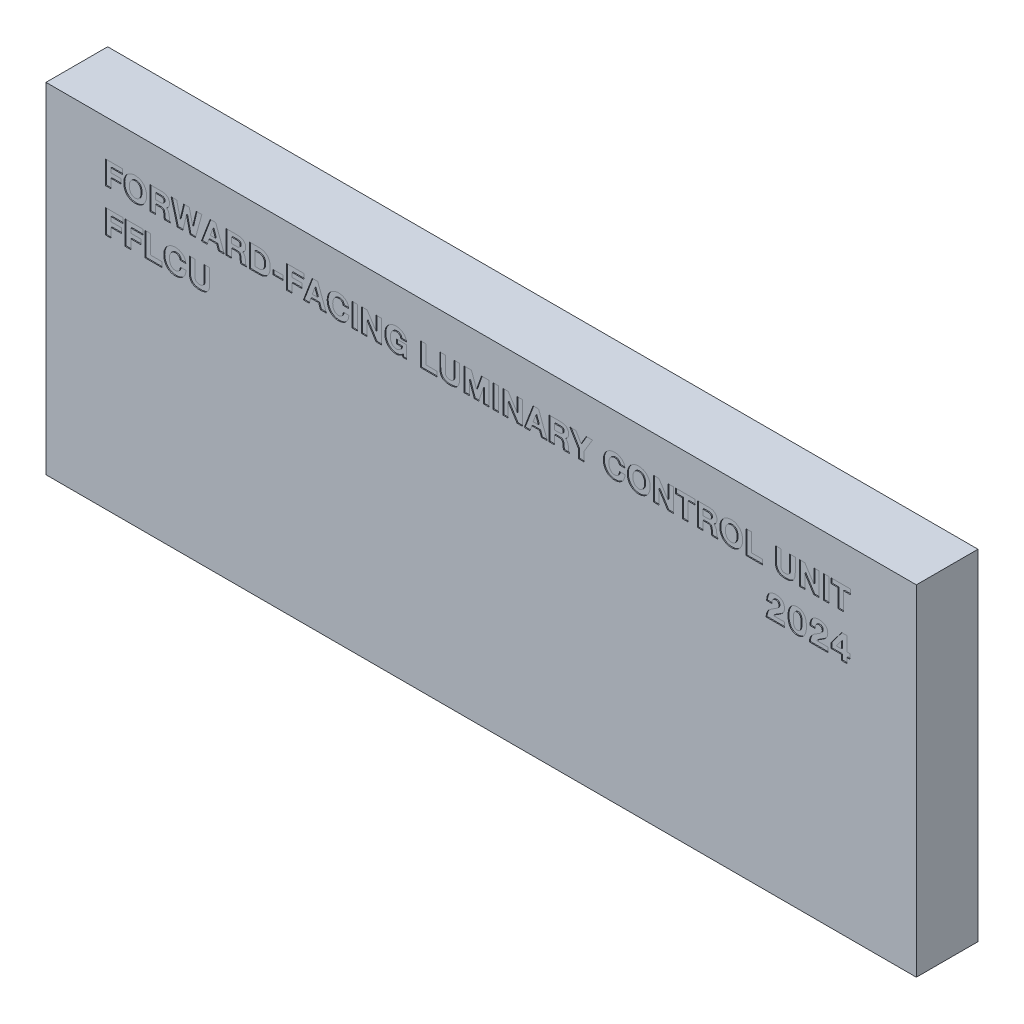
from build123d import *

# Parameters (mm, degrees)
SKETCH1_W           = 89.63
SKETCH1_H           = 35
BOSS_EXTRUDE1_DEPTH = 6.35
SKETCH4_W           = 1.051428982
SKETCH4_H           = 0.473966126
SKETCH4_W_2         = 0.56752065
SKETCH4_H_2         = 2.383358548
CUT_EXTRUDE1_DEPTH  = 0.1


with BuildPart() as part:
    # Sketch1 → Boss-Extrude1 (new body)
    with BuildSketch(Plane.XY):
        Rectangle(SKETCH1_W, SKETCH1_H)
    extrude(amount=BOSS_EXTRUDE1_DEPTH)

    # Sketch4 → Cut-Extrude1 (cut)
    # profile 1 of 42: a face of its own
    with BuildSketch(Plane.XY.offset(6.35)):
        Polygon((-38.698970541, 13.7340405), (-36.913122247, 13.7340405), (-36.913122247, 13.219979578), (-38.131449892, 13.219979578), (-38.131449892, 12.776003056), (-37.106750775, 12.776003056), (-37.106750775, 12.281989532), (-38.131449892, 12.281989532), (-38.131449892, 11.350681952), (-38.698970541, 11.350681952), align=None)
    # profile 2 of 42: a face of its own
    with BuildSketch(Plane.XY.offset(6.35)):
        with BuildLine():
            Line((-34.105834576, 13.7340405), (-32.934284193, 13.7340405))
            add(Edge.make_bspline(
                [(-32.934284193, 13.7340405), (-32.827527724, 13.7340405), (-32.724030994, 13.722794398), (-32.623794004, 13.700628169)],
                knots=[1, 1, 1, 1, 2, 2, 2, 2], degree=3))
            add(Edge.make_bspline(
                [(-32.623794004, 13.700628169), (-32.523720001, 13.678298954), (-32.434729112, 13.640974936), (-32.356821338, 13.588819104)],
                knots=[2, 2, 2, 2, 3, 3, 3, 3], degree=3))
            add(Edge.make_bspline(
                [(-32.356821338, 13.588819104), (-32.278913563, 13.536500285), (-32.216652539, 13.466904846), (-32.169875277, 13.380195775)],
                knots=[3, 3, 3, 3, 4, 4, 4, 4], degree=3))
            add(Edge.make_bspline(
                [(-32.169875277, 13.380195775), (-32.123098015, 13.293323717), (-32.099790877, 13.185426339), (-32.099790877, 13.056340654)],
                knots=[4, 4, 4, 4, 5, 5, 5, 5], degree=3))
            add(Edge.make_bspline(
                [(-32.099790877, 13.056340654), (-32.099790877, 12.971750414), (-32.11038503, 12.897265366), (-32.13141035, 12.832722523)],
                knots=[5, 5, 5, 5, 6, 6, 6, 6], degree=3))
            add(Edge.make_bspline(
                [(-32.13141035, 12.832722523), (-32.152598657, 12.768179681), (-32.17883956, 12.713090083), (-32.209970073, 12.66745373)],
                knots=[6, 6, 6, 6, 7, 7, 7, 7], degree=3))
            add(Edge.make_bspline(
                [(-32.209970073, 12.66745373), (-32.241100585, 12.621817376), (-32.275001876, 12.583515437), (-32.311673946, 12.552384925)],
                knots=[7, 7, 7, 7, 8, 8, 8, 8], degree=3))
            add(Edge.make_bspline(
                [(-32.311673946, 12.552384925), (-32.348509002, 12.521091425), (-32.382410293, 12.496643379), (-32.413540806, 12.478877799)],
                knots=[8, 8, 8, 8, 9, 9, 9, 9], degree=3))
            add(Edge.make_bspline(
                [(-32.413540806, 12.478877799), (-32.306784336, 12.421017422), (-32.233929158, 12.342620687), (-32.194975271, 12.243524606)],
                knots=[9, 9, 9, 9, 10, 10, 10, 10], degree=3))
            add(Edge.make_bspline(
                [(-32.194975271, 12.243524606), (-32.156021384, 12.144591511), (-32.133203207, 12.037183094), (-32.126520741, 11.921462341)],
                knots=[10, 10, 10, 10, 11, 11, 11, 11], degree=3))
            Line((-32.126520741, 11.921462341), (-32.109733083, 11.69784421))
            add(Edge.make_bspline(
                [(-32.109733083, 11.69784421), (-32.105332434, 11.637702016), (-32.098649968, 11.588153976), (-32.089685685, 11.549363076)],
                knots=[12, 12, 12, 12, 13, 13, 13, 13], degree=3))
            add(Edge.make_bspline(
                [(-32.089685685, 11.549363076), (-32.080884388, 11.510409188), (-32.070290234, 11.47797478), (-32.058066211, 11.452548812)],
                knots=[13, 13, 13, 13, 14, 14, 14, 14], degree=3))
            add(Edge.make_bspline(
                [(-32.058066211, 11.452548812), (-32.045842188, 11.426959857), (-32.032966217, 11.406260511), (-32.019601285, 11.390776748)],
                knots=[14, 14, 14, 14, 15, 15, 15, 15], degree=3))
            add(Edge.make_bspline(
                [(-32.019601285, 11.390776748), (-32.006236353, 11.375129998), (-31.994175317, 11.361765066), (-31.982929215, 11.350681952)],
                knots=[15, 15, 15, 15, 16, 16, 16, 16], degree=3))
            Line((-31.982929215, 11.350681952), (-32.600486867, 11.350681952))
            add(Edge.make_bspline(
                [(-32.600486867, 11.350681952), (-32.618252447, 11.364046884), (-32.632758288, 11.403489732), (-32.643841402, 11.469173483)],
                knots=[17, 17, 17, 17, 18, 18, 18, 18], degree=3))
            add(Edge.make_bspline(
                [(-32.643841402, 11.469173483), (-32.655087504, 11.534857235), (-32.665029709, 11.632160459), (-32.673831006, 11.761246144)],
                knots=[18, 18, 18, 18, 19, 19, 19, 19], degree=3))
            add(Edge.make_bspline(
                [(-32.673831006, 11.761246144), (-32.680513472, 11.868002613), (-32.692900482, 11.953244802), (-32.710666062, 12.016646735)],
                knots=[19, 19, 19, 19, 20, 20, 20, 20], degree=3))
            add(Edge.make_bspline(
                [(-32.710666062, 12.016646735), (-32.728431643, 12.080048669), (-32.755161507, 12.128944762), (-32.790692668, 12.163498)],
                knots=[20, 20, 20, 20, 21, 21, 21, 21], degree=3))
            add(Edge.make_bspline(
                [(-32.790692668, 12.163498), (-32.826386815, 12.197888252), (-32.872512129, 12.220217468), (-32.929231597, 12.230159674)],
                knots=[21, 21, 21, 21, 22, 22, 22, 22], degree=3))
            add(Edge.make_bspline(
                [(-32.929231597, 12.230159674), (-32.985951065, 12.240264866), (-33.056687412, 12.245317462), (-33.141277653, 12.245317462)],
                knots=[22, 22, 22, 22, 23, 23, 23, 23], degree=3))
            Line((-33.141277653, 12.245317462), (-33.538476913, 12.245317462))
            Line((-33.538476913, 12.245317462), (-33.538476913, 11.350681952))
            Line((-33.538476913, 11.350681952), (-34.105834576, 11.350681952))
            Line((-34.105834576, 11.350681952), (-34.105834576, 13.7340405))
        make_face()
        with BuildLine():
            Line((-33.538476913, 12.679188792), (-33.064510787, 12.679188792))
            add(Edge.make_bspline(
                [(-33.064510787, 12.679188792), (-33.026697809, 12.679188792), (-32.984321195, 12.680818662), (-32.937543933, 12.684241388)],
                knots=[1, 1, 1, 1, 2, 2, 2, 2], degree=3))
            add(Edge.make_bspline(
                [(-32.937543933, 12.684241388), (-32.890929658, 12.687501128), (-32.847412135, 12.698095281), (-32.807480326, 12.715860862)],
                knots=[2, 2, 2, 2, 3, 3, 3, 3], degree=3))
            add(Edge.make_bspline(
                [(-32.807480326, 12.715860862), (-32.76738553, 12.733626442), (-32.7339732, 12.762638124), (-32.707243336, 12.80273292)],
                knots=[3, 3, 3, 3, 4, 4, 4, 4], degree=3))
            add(Edge.make_bspline(
                [(-32.707243336, 12.80273292), (-32.680513472, 12.842827716), (-32.66714854, 12.899547183), (-32.66714854, 12.972891322)],
                knots=[4, 4, 4, 4, 5, 5, 5, 5], degree=3))
            add(Edge.make_bspline(
                [(-32.66714854, 12.972891322), (-32.66714854, 13.044116631), (-32.680513472, 13.099206229), (-32.707243336, 13.138160116)],
                knots=[5, 5, 5, 5, 6, 6, 6, 6], degree=3))
            add(Edge.make_bspline(
                [(-32.707243336, 13.138160116), (-32.7339732, 13.177114003), (-32.76738553, 13.205473737), (-32.807480326, 13.223239317)],
                knots=[6, 6, 6, 6, 7, 7, 7, 7], degree=3))
            add(Edge.make_bspline(
                [(-32.807480326, 13.223239317), (-32.847412135, 13.241004898), (-32.890929658, 13.251599051), (-32.937543933, 13.255021778)],
                knots=[7, 7, 7, 7, 8, 8, 8, 8], degree=3))
            add(Edge.make_bspline(
                [(-32.937543933, 13.255021778), (-32.984321195, 13.258281517), (-33.026697809, 13.260074374), (-33.064510787, 13.260074374)],
                knots=[8, 8, 8, 8, 9, 9, 9, 9], degree=3))
            Line((-33.064510787, 13.260074374), (-33.538476913, 13.260074374))
            Line((-33.538476913, 13.260074374), (-33.538476913, 12.679188792))
        make_face(mode=Mode.SUBTRACT)
    # profile 3 of 42: a face of its own
    with BuildSketch(Plane.XY.offset(6.35)):
        Polygon((-29.422729799, 11.350681952), (-29.990250449, 11.350681952), (-30.344095173, 12.919594581), (-30.350777639, 12.919594581), (-30.714564569, 11.350681952), (-31.295450151, 11.350681952), (-31.929632474, 13.7340405), (-31.348746892, 13.7340405), (-31.001747621, 12.23195253), (-30.995065155, 12.23195253), (-30.627855498, 13.7340405), (-30.060334848, 13.7340405), (-29.706490124, 12.23195253), (-29.699807658, 12.23195253), (-29.345962933, 13.7340405), (-28.765240339, 13.7340405), align=None)
    # profile 4 of 42: a face of its own
    with BuildSketch(Plane.XY.offset(6.35)):
        Polygon((-27.910699624, 13.7340405), (-27.343341961, 13.7340405), (-26.445283725, 11.350681952), (-27.05289917, 11.350681952), (-27.236422505, 11.881367545), (-28.040926218, 11.881367545), (-28.224449553, 11.350681952), (-28.812017601, 11.350681952), align=None)
        Polygon((-27.626939299, 13.039715983), (-27.633621765, 13.039715983), (-27.894074953, 12.315401862), (-27.373331565, 12.315401862), align=None, mode=Mode.SUBTRACT)
    # profile 5 of 42: a face of its own
    with BuildSketch(Plane.XY.offset(6.35)):
        with BuildLine():
            Line((-26.258337663, 13.7340405), (-25.086787281, 13.7340405))
            add(Edge.make_bspline(
                [(-25.086787281, 13.7340405), (-24.980030812, 13.7340405), (-24.876534082, 13.722794398), (-24.776297092, 13.700628169)],
                knots=[1, 1, 1, 1, 2, 2, 2, 2], degree=3))
            add(Edge.make_bspline(
                [(-24.776297092, 13.700628169), (-24.676223089, 13.678298954), (-24.5872322, 13.640974936), (-24.509324426, 13.588819104)],
                knots=[2, 2, 2, 2, 3, 3, 3, 3], degree=3))
            add(Edge.make_bspline(
                [(-24.509324426, 13.588819104), (-24.431416651, 13.536500285), (-24.369155626, 13.466904846), (-24.322378364, 13.380195775)],
                knots=[3, 3, 3, 3, 4, 4, 4, 4], degree=3))
            add(Edge.make_bspline(
                [(-24.322378364, 13.380195775), (-24.275601102, 13.293323717), (-24.252293965, 13.185426339), (-24.252293965, 13.056340654)],
                knots=[4, 4, 4, 4, 5, 5, 5, 5], degree=3))
            add(Edge.make_bspline(
                [(-24.252293965, 13.056340654), (-24.252293965, 12.971750414), (-24.262888118, 12.897265366), (-24.283913438, 12.832722523)],
                knots=[5, 5, 5, 5, 6, 6, 6, 6], degree=3))
            add(Edge.make_bspline(
                [(-24.283913438, 12.832722523), (-24.305101745, 12.768179681), (-24.331342648, 12.713090083), (-24.36247316, 12.66745373)],
                knots=[6, 6, 6, 6, 7, 7, 7, 7], degree=3))
            add(Edge.make_bspline(
                [(-24.36247316, 12.66745373), (-24.393603673, 12.621817376), (-24.427504964, 12.583515437), (-24.464177033, 12.552384925)],
                knots=[7, 7, 7, 7, 8, 8, 8, 8], degree=3))
            add(Edge.make_bspline(
                [(-24.464177033, 12.552384925), (-24.50101209, 12.521091425), (-24.534913381, 12.496643379), (-24.566043893, 12.478877799)],
                knots=[8, 8, 8, 8, 9, 9, 9, 9], degree=3))
            add(Edge.make_bspline(
                [(-24.566043893, 12.478877799), (-24.459287424, 12.421017422), (-24.386432246, 12.342620687), (-24.347478359, 12.243524606)],
                knots=[9, 9, 9, 9, 10, 10, 10, 10], degree=3))
            add(Edge.make_bspline(
                [(-24.347478359, 12.243524606), (-24.308524471, 12.144591511), (-24.285706295, 12.037183094), (-24.279023829, 11.921462341)],
                knots=[10, 10, 10, 10, 11, 11, 11, 11], degree=3))
            Line((-24.279023829, 11.921462341), (-24.26223617, 11.69784421))
            add(Edge.make_bspline(
                [(-24.26223617, 11.69784421), (-24.257835522, 11.637702016), (-24.251153056, 11.588153976), (-24.242188772, 11.549363076)],
                knots=[12, 12, 12, 12, 13, 13, 13, 13], degree=3))
            add(Edge.make_bspline(
                [(-24.242188772, 11.549363076), (-24.233387476, 11.510409188), (-24.222793322, 11.47797478), (-24.210569299, 11.452548812)],
                knots=[13, 13, 13, 13, 14, 14, 14, 14], degree=3))
            add(Edge.make_bspline(
                [(-24.210569299, 11.452548812), (-24.198345276, 11.426959857), (-24.185469305, 11.406260511), (-24.172104373, 11.390776748)],
                knots=[14, 14, 14, 14, 15, 15, 15, 15], degree=3))
            add(Edge.make_bspline(
                [(-24.172104373, 11.390776748), (-24.158739441, 11.375129998), (-24.146678404, 11.361765066), (-24.135432303, 11.350681952)],
                knots=[15, 15, 15, 15, 16, 16, 16, 16], degree=3))
            Line((-24.135432303, 11.350681952), (-24.752989955, 11.350681952))
            add(Edge.make_bspline(
                [(-24.752989955, 11.350681952), (-24.770755535, 11.364046884), (-24.785261376, 11.403489732), (-24.79634449, 11.469173483)],
                knots=[17, 17, 17, 17, 18, 18, 18, 18], degree=3))
            add(Edge.make_bspline(
                [(-24.79634449, 11.469173483), (-24.807590591, 11.534857235), (-24.817532797, 11.632160459), (-24.826334094, 11.761246144)],
                knots=[18, 18, 18, 18, 19, 19, 19, 19], degree=3))
            add(Edge.make_bspline(
                [(-24.826334094, 11.761246144), (-24.83301656, 11.868002613), (-24.84540357, 11.953244802), (-24.86316915, 12.016646735)],
                knots=[19, 19, 19, 19, 20, 20, 20, 20], degree=3))
            add(Edge.make_bspline(
                [(-24.86316915, 12.016646735), (-24.880934731, 12.080048669), (-24.907664595, 12.128944762), (-24.943195755, 12.163498)],
                knots=[20, 20, 20, 20, 21, 21, 21, 21], degree=3))
            add(Edge.make_bspline(
                [(-24.943195755, 12.163498), (-24.978889903, 12.197888252), (-25.025015217, 12.220217468), (-25.081734685, 12.230159674)],
                knots=[21, 21, 21, 21, 22, 22, 22, 22], degree=3))
            add(Edge.make_bspline(
                [(-25.081734685, 12.230159674), (-25.138454152, 12.240264866), (-25.2091905, 12.245317462), (-25.29378074, 12.245317462)],
                knots=[22, 22, 22, 22, 23, 23, 23, 23], degree=3))
            Line((-25.29378074, 12.245317462), (-25.69098, 12.245317462))
            Line((-25.69098, 12.245317462), (-25.69098, 11.350681952))
            Line((-25.69098, 11.350681952), (-26.258337663, 11.350681952))
            Line((-26.258337663, 11.350681952), (-26.258337663, 13.7340405))
        make_face()
        with BuildLine():
            Line((-25.69098, 12.679188792), (-25.217013875, 12.679188792))
            add(Edge.make_bspline(
                [(-25.217013875, 12.679188792), (-25.179200896, 12.679188792), (-25.136824283, 12.680818662), (-25.090047021, 12.684241388)],
                knots=[1, 1, 1, 1, 2, 2, 2, 2], degree=3))
            add(Edge.make_bspline(
                [(-25.090047021, 12.684241388), (-25.043432745, 12.687501128), (-24.999915223, 12.698095281), (-24.959983414, 12.715860862)],
                knots=[2, 2, 2, 2, 3, 3, 3, 3], degree=3))
            add(Edge.make_bspline(
                [(-24.959983414, 12.715860862), (-24.919888618, 12.733626442), (-24.886476288, 12.762638124), (-24.859746424, 12.80273292)],
                knots=[3, 3, 3, 3, 4, 4, 4, 4], degree=3))
            add(Edge.make_bspline(
                [(-24.859746424, 12.80273292), (-24.83301656, 12.842827716), (-24.819651628, 12.899547183), (-24.819651628, 12.972891322)],
                knots=[4, 4, 4, 4, 5, 5, 5, 5], degree=3))
            add(Edge.make_bspline(
                [(-24.819651628, 12.972891322), (-24.819651628, 13.044116631), (-24.83301656, 13.099206229), (-24.859746424, 13.138160116)],
                knots=[5, 5, 5, 5, 6, 6, 6, 6], degree=3))
            add(Edge.make_bspline(
                [(-24.859746424, 13.138160116), (-24.886476288, 13.177114003), (-24.919888618, 13.205473737), (-24.959983414, 13.223239317)],
                knots=[6, 6, 6, 6, 7, 7, 7, 7], degree=3))
            add(Edge.make_bspline(
                [(-24.959983414, 13.223239317), (-24.999915223, 13.241004898), (-25.043432745, 13.251599051), (-25.090047021, 13.255021778)],
                knots=[7, 7, 7, 7, 8, 8, 8, 8], degree=3))
            add(Edge.make_bspline(
                [(-25.090047021, 13.255021778), (-25.136824283, 13.258281517), (-25.179200896, 13.260074374), (-25.217013875, 13.260074374)],
                knots=[8, 8, 8, 8, 9, 9, 9, 9], degree=3))
            Line((-25.217013875, 13.260074374), (-25.69098, 13.260074374))
            Line((-25.69098, 13.260074374), (-25.69098, 12.679188792))
        make_face(mode=Mode.SUBTRACT)
    # profile 6 of 42: a face of its own
    with BuildSketch(Plane.XY.offset(6.35)):
        with BuildLine():
            Line((-23.848412239, 13.7340405), (-22.867067657, 13.7340405))
            add(Edge.make_bspline(
                [(-22.867067657, 13.7340405), (-22.700168994, 13.7340405), (-22.546635263, 13.710081414), (-22.406466463, 13.662163243)],
                knots=[1, 1, 1, 1, 2, 2, 2, 2], degree=3))
            add(Edge.make_bspline(
                [(-22.406466463, 13.662163243), (-22.266297664, 13.614408059), (-22.146176263, 13.541552881), (-22.045939273, 13.443597709)],
                knots=[2, 2, 2, 2, 3, 3, 3, 3], degree=3))
            add(Edge.make_bspline(
                [(-22.045939273, 13.443597709), (-21.94586527, 13.345642536), (-21.867305547, 13.221609448), (-21.81058608, 13.071335456)],
                knots=[3, 3, 3, 3, 4, 4, 4, 4], degree=3))
            add(Edge.make_bspline(
                [(-21.81058608, 13.071335456), (-21.753866612, 12.921224451), (-21.725506878, 12.744872543), (-21.725506878, 12.542279732)],
                knots=[4, 4, 4, 4, 5, 5, 5, 5], degree=3))
            add(Edge.make_bspline(
                [(-21.725506878, 12.542279732), (-21.725506878, 12.337568091), (-21.753866612, 12.160727222), (-21.81058608, 12.011594139)],
                knots=[5, 5, 5, 5, 6, 6, 6, 6], degree=3))
            add(Edge.make_bspline(
                [(-21.81058608, 12.011594139), (-21.867305547, 11.862461056), (-21.94586527, 11.738916928), (-22.045939273, 11.641124743)],
                knots=[6, 6, 6, 6, 7, 7, 7, 7], degree=3))
            add(Edge.make_bspline(
                [(-22.045939273, 11.641124743), (-22.146176263, 11.54316957), (-22.266297664, 11.470314392), (-22.406466463, 11.422396221)],
                knots=[7, 7, 7, 7, 8, 8, 8, 8], degree=3))
            add(Edge.make_bspline(
                [(-22.406466463, 11.422396221), (-22.546635263, 11.374641037), (-22.700168994, 11.350681952), (-22.867067657, 11.350681952)],
                knots=[8, 8, 8, 8, 9, 9, 9, 9], degree=3))
            Line((-22.867067657, 11.350681952), (-23.848412239, 11.350681952))
            Line((-23.848412239, 11.350681952), (-23.848412239, 13.7340405))
        make_face()
        with BuildLine():
            Line((-23.281054576, 11.844695476), (-22.913844919, 11.844695476))
            add(Edge.make_bspline(
                [(-22.913844919, 11.844695476), (-22.893797521, 11.844695476), (-22.864296879, 11.845836385), (-22.825342991, 11.848118202)],
                knots=[1, 1, 1, 1, 2, 2, 2, 2], degree=3))
            add(Edge.make_bspline(
                [(-22.825342991, 11.848118202), (-22.786552091, 11.850237033), (-22.744175477, 11.858060408), (-22.698539124, 11.87142534)],
                knots=[2, 2, 2, 2, 3, 3, 3, 3], degree=3))
            add(Edge.make_bspline(
                [(-22.698539124, 11.87142534), (-22.652902771, 11.884790272), (-22.606288496, 11.905326631), (-22.558370325, 11.933197404)],
                knots=[3, 3, 3, 3, 4, 4, 4, 4], degree=3))
            add(Edge.make_bspline(
                [(-22.558370325, 11.933197404), (-22.510452154, 11.960905189), (-22.467097618, 12.000511025), (-22.428143731, 12.051688935)],
                knots=[4, 4, 4, 4, 5, 5, 5, 5], degree=3))
            add(Edge.make_bspline(
                [(-22.428143731, 12.051688935), (-22.389189844, 12.102866845), (-22.356918423, 12.168550597), (-22.331329468, 12.248577202)],
                knots=[5, 5, 5, 5, 6, 6, 6, 6], degree=3))
            add(Edge.make_bspline(
                [(-22.331329468, 12.248577202), (-22.305740512, 12.328766794), (-22.293027528, 12.426558979), (-22.293027528, 12.542279732)],
                knots=[6, 6, 6, 6, 7, 7, 7, 7], degree=3))
            add(Edge.make_bspline(
                [(-22.293027528, 12.542279732), (-22.293027528, 12.658000485), (-22.305740512, 12.755955658), (-22.331329468, 12.83614525)],
                knots=[7, 7, 7, 7, 8, 8, 8, 8], degree=3))
            add(Edge.make_bspline(
                [(-22.331329468, 12.83614525), (-22.356918423, 12.916171855), (-22.389189844, 12.981855606), (-22.428143731, 13.033033516)],
                knots=[8, 8, 8, 8, 9, 9, 9, 9], degree=3))
            add(Edge.make_bspline(
                [(-22.428143731, 13.033033516), (-22.467097618, 13.084211427), (-22.510452154, 13.123654275), (-22.558370325, 13.151525048)],
                knots=[9, 9, 9, 9, 10, 10, 10, 10], degree=3))
            add(Edge.make_bspline(
                [(-22.558370325, 13.151525048), (-22.606288496, 13.179395821), (-22.652902771, 13.19993218), (-22.698539124, 13.213297112)],
                knots=[10, 10, 10, 10, 11, 11, 11, 11], degree=3))
            add(Edge.make_bspline(
                [(-22.698539124, 13.213297112), (-22.744175477, 13.226662044), (-22.786552091, 13.234322432), (-22.825342991, 13.236604249)],
                knots=[11, 11, 11, 11, 12, 12, 12, 12], degree=3))
            add(Edge.make_bspline(
                [(-22.825342991, 13.236604249), (-22.864296879, 13.238886067), (-22.893797521, 13.240026976), (-22.913844919, 13.240026976)],
                knots=[12, 12, 12, 12, 13, 13, 13, 13], degree=3))
            Line((-22.913844919, 13.240026976), (-23.281054576, 13.240026976))
            Line((-23.281054576, 13.240026976), (-23.281054576, 11.844695476))
        make_face(mode=Mode.SUBTRACT)
    # profile 7 of 42: a face of its own
    with BuildSketch(Plane.XY.offset(6.35)):
        with Locations((-20.922714529, 12.2686246)):
            Rectangle(SKETCH4_W, SKETCH4_H)
    # profile 8 of 42: a face of its own
    with BuildSketch(Plane.XY.offset(6.35)):
        Polygon((-20.033213108, 13.7340405), (-18.247364814, 13.7340405), (-18.247364814, 13.219979578), (-19.465692459, 13.219979578), (-19.465692459, 12.776003056), (-18.440993342, 12.776003056), (-18.440993342, 12.281989532), (-19.465692459, 12.281989532), (-19.465692459, 11.350681952), (-20.033213108, 11.350681952), align=None)
    # profile 9 of 42: a face of its own
    with BuildSketch(Plane.XY.offset(6.35)):
        Polygon((-17.402929292, 13.7340405), (-16.83557163, 13.7340405), (-15.937513393, 11.350681952), (-16.545128839, 11.350681952), (-16.728652173, 11.881367545), (-17.533155886, 11.881367545), (-17.716679221, 11.350681952), (-18.304247269, 11.350681952), align=None)
        Polygon((-17.119168968, 13.039715983), (-17.125851434, 13.039715983), (-17.386304621, 12.315401862), (-16.865561233, 12.315401862), align=None, mode=Mode.SUBTRACT)
    # profile 10 of 42: a face of its own
    with BuildSketch(Plane.XY.offset(6.35)):
        with BuildLine():
            Line((-13.647709369, 12.906229649), (-14.201865087, 12.906229649))
            add(Edge.make_bspline(
                [(-14.201865087, 12.906229649), (-14.226313134, 13.037434165), (-14.279772862, 13.138160116), (-14.362081284, 13.208244516)],
                knots=[19, 19, 19, 19, 20, 20, 20, 20], degree=3))
            add(Edge.make_bspline(
                [(-14.362081284, 13.208244516), (-14.444389707, 13.278328915), (-14.550168254, 13.313371115), (-14.679090952, 13.313371115)],
                knots=[20, 20, 20, 20, 21, 21, 21, 21], degree=3))
            add(Edge.make_bspline(
                [(-14.679090952, 13.313371115), (-14.750316261, 13.313371115), (-14.821541569, 13.300006183), (-14.892766878, 13.273276319)],
                knots=[21, 21, 21, 21, 22, 22, 22, 22], degree=3))
            add(Edge.make_bspline(
                [(-14.892766878, 13.273276319), (-14.963992186, 13.246709442), (-15.029023989, 13.202702958), (-15.088025275, 13.141582842)],
                knots=[22, 22, 22, 22, 23, 23, 23, 23], degree=3))
            add(Edge.make_bspline(
                [(-15.088025275, 13.141582842), (-15.14702656, 13.080299739), (-15.194781744, 13.000762095), (-15.2316168, 12.902806923)],
                knots=[23, 23, 23, 23, 24, 24, 24, 24], degree=3))
            add(Edge.make_bspline(
                [(-15.2316168, 12.902806923), (-15.26828887, 12.80485175), (-15.286706398, 12.684730349), (-15.286706398, 12.542279732)],
                knots=[24, 24, 24, 24, 25, 25, 25, 25], degree=3))
            add(Edge.make_bspline(
                [(-15.286706398, 12.542279732), (-15.286706398, 12.399829115), (-15.26828887, 12.279707714), (-15.2316168, 12.181915529)],
                knots=[25, 25, 25, 25, 26, 26, 26, 26], degree=3))
            add(Edge.make_bspline(
                [(-15.2316168, 12.181915529), (-15.194781744, 12.083960356), (-15.148167469, 12.004422712), (-15.091448001, 11.943139609)],
                knots=[26, 26, 26, 26, 27, 27, 27, 27], degree=3))
            add(Edge.make_bspline(
                [(-15.091448001, 11.943139609), (-15.034565547, 11.882019493), (-14.971815561, 11.83801301), (-14.902709083, 11.811283146)],
                knots=[27, 27, 27, 27, 28, 28, 28, 28], degree=3))
            add(Edge.make_bspline(
                [(-14.902709083, 11.811283146), (-14.833765592, 11.784553282), (-14.767103919, 11.77118835), (-14.702561077, 11.77118835)],
                knots=[28, 28, 28, 28, 29, 29, 29, 29], degree=3))
            add(Edge.make_bspline(
                [(-14.702561077, 11.77118835), (-14.606887722, 11.77118835), (-14.526209169, 11.789605878), (-14.460525418, 11.826277947)],
                knots=[29, 29, 29, 29, 30, 30, 30, 30], degree=3))
            add(Edge.make_bspline(
                [(-14.460525418, 11.826277947), (-14.394841667, 11.863113004), (-14.342522847, 11.90858637), (-14.30356896, 11.963187007)],
                knots=[30, 30, 30, 30, 31, 31, 31, 31], degree=3))
            add(Edge.make_bspline(
                [(-14.30356896, 11.963187007), (-14.26477806, 12.017624657), (-14.236907287, 12.076625942), (-14.220119628, 12.140190863)],
                knots=[31, 31, 31, 31, 32, 32, 32, 32], degree=3))
            add(Edge.make_bspline(
                [(-14.220119628, 12.140190863), (-14.203494957, 12.203592796), (-14.195182621, 12.261942134), (-14.195182621, 12.315401862)],
                knots=[32, 32, 32, 32, 33, 33, 33, 33], degree=3))
            Line((-14.195182621, 12.315401862), (-13.627661971, 12.315401862))
            add(Edge.make_bspline(
                [(-13.627661971, 12.315401862), (-13.627661971, 12.25297785), (-13.634996385, 12.18452332), (-13.649339239, 12.110038272)],
                knots=[0, 0, 0, 0, 1, 1, 1, 1], degree=3))
            add(Edge.make_bspline(
                [(-13.649339239, 12.110038272), (-13.66384508, 12.035553224), (-13.687804165, 11.960416229), (-13.721216495, 11.884790272)],
                knots=[1, 1, 1, 1, 2, 2, 2, 2], degree=3))
            add(Edge.make_bspline(
                [(-13.721216495, 11.884790272), (-13.754465838, 11.809001328), (-13.798472322, 11.73614615), (-13.852909972, 11.66606175)],
                knots=[2, 2, 2, 2, 3, 3, 3, 3], degree=3))
            add(Edge.make_bspline(
                [(-13.852909972, 11.66606175), (-13.907510609, 11.595977351), (-13.97482423, 11.533716326), (-14.055013822, 11.479115689)],
                knots=[3, 3, 3, 3, 4, 4, 4, 4], degree=3))
            add(Edge.make_bspline(
                [(-14.055013822, 11.479115689), (-14.135040427, 11.424678039), (-14.228431964, 11.380671556), (-14.33535142, 11.347422212)],
                knots=[4, 4, 4, 4, 5, 5, 5, 5], degree=3))
            add(Edge.make_bspline(
                [(-14.33535142, 11.347422212), (-14.44210789, 11.314009882), (-14.564511108, 11.297222224), (-14.702561077, 11.297222224)],
                knots=[5, 5, 5, 5, 6, 6, 6, 6], degree=3))
            add(Edge.make_bspline(
                [(-14.702561077, 11.297222224), (-14.864896105, 11.297222224), (-15.016311005, 11.326722867), (-15.156479805, 11.385724152)],
                knots=[6, 6, 6, 6, 7, 7, 7, 7], degree=3))
            add(Edge.make_bspline(
                [(-15.156479805, 11.385724152), (-15.296648604, 11.444725437), (-15.418562862, 11.528174769), (-15.521896604, 11.636072147)],
                knots=[7, 7, 7, 7, 8, 8, 8, 8], degree=3))
            add(Edge.make_bspline(
                [(-15.521896604, 11.636072147), (-15.625393334, 11.743969525), (-15.706723835, 11.874685079), (-15.76572512, 12.02821881)],
                knots=[8, 8, 8, 8, 9, 9, 9, 9], degree=3))
            add(Edge.make_bspline(
                [(-15.76572512, 12.02821881), (-15.824563419, 12.181915529), (-15.854064061, 12.35321484), (-15.854064061, 12.542279732)],
                knots=[9, 9, 9, 9, 10, 10, 10, 10], degree=3))
            add(Edge.make_bspline(
                [(-15.854064061, 12.542279732), (-15.854064061, 12.731507611), (-15.824563419, 12.902806923), (-15.76572512, 13.056340654)],
                knots=[10, 10, 10, 10, 11, 11, 11, 11], degree=3))
            add(Edge.make_bspline(
                [(-15.76572512, 13.056340654), (-15.706723835, 13.209874385), (-15.624904373, 13.34058994), (-15.520266735, 13.448650305)],
                knots=[11, 11, 11, 11, 12, 12, 12, 12], degree=3))
            add(Edge.make_bspline(
                [(-15.520266735, 13.448650305), (-15.415792083, 13.556547683), (-15.291596008, 13.639997014), (-15.148167469, 13.6989983)],
                knots=[12, 12, 12, 12, 13, 13, 13, 13], degree=3))
            add(Edge.make_bspline(
                [(-15.148167469, 13.6989983), (-15.004575943, 13.757836598), (-14.848271433, 13.787337241), (-14.679090952, 13.787337241)],
                knots=[13, 13, 13, 13, 14, 14, 14, 14], degree=3))
            add(Edge.make_bspline(
                [(-14.679090952, 13.787337241), (-14.547886437, 13.787337241), (-14.419941661, 13.765659973), (-14.295256624, 13.722305437)],
                knots=[14, 14, 14, 14, 15, 15, 15, 15], degree=3))
            add(Edge.make_bspline(
                [(-14.295256624, 13.722305437), (-14.170734575, 13.678950902), (-14.060555379, 13.618319747), (-13.964882024, 13.540411972)],
                knots=[15, 15, 15, 15, 16, 16, 16, 16], degree=3))
            add(Edge.make_bspline(
                [(-13.964882024, 13.540411972), (-13.869208669, 13.462504198), (-13.792441804, 13.369601622), (-13.73441844, 13.261704244)],
                knots=[16, 16, 16, 16, 17, 17, 17, 17], degree=3))
            add(Edge.make_bspline(
                [(-13.73441844, 13.261704244), (-13.676721051, 13.153643879), (-13.647709369, 13.035152347), (-13.647709369, 12.906229649)],
                knots=[17, 17, 17, 17, 18, 18, 18, 18], degree=3))
        make_face()
    # profile 11 of 42: a face of its own
    with BuildSketch(Plane.XY.offset(6.35)):
        with Locations((-13.01010432, 12.542361226)):
            Rectangle(SKETCH4_W_2, SKETCH4_H_2)
    # profile 12 of 42: a face of its own
    with BuildSketch(Plane.XY.offset(6.35)):
        Polygon((-12.299318118, 13.7340405), (-11.7451624, 13.7340405), (-10.820537287, 12.308719396), (-10.813854821, 12.308719396), (-10.813854821, 13.7340405), (-10.25986209, 13.7340405), (-10.25986209, 11.350681952), (-10.827219753, 11.350681952), (-11.738479934, 12.792627727), (-11.7451624, 12.792627727), (-11.7451624, 11.350681952), (-12.299318118, 11.350681952), align=None)
    # profile 13 of 42: a face of its own
    with BuildSketch(Plane.XY.offset(6.35)):
        with BuildLine():
            Line((-8.724198803, 12.66256412), (-7.686134754, 12.66256412))
            Line((-7.686134754, 12.66256412), (-7.686134754, 11.350681952))
            Line((-7.686134754, 11.350681952), (-8.063286616, 11.350681952))
            Line((-8.063286616, 11.350681952), (-8.120169071, 11.571040343))
            add(Edge.make_bspline(
                [(-8.120169071, 11.571040343), (-8.220243074, 11.470803353), (-8.323250843, 11.400229993), (-8.428866403, 11.358994288)],
                knots=[4, 4, 4, 4, 5, 5, 5, 5], degree=3))
            add(Edge.make_bspline(
                [(-8.428866403, 11.358994288), (-8.534644951, 11.31792157), (-8.656396221, 11.297222224), (-8.794283203, 11.297222224)],
                knots=[5, 5, 5, 5, 6, 6, 6, 6], degree=3))
            add(Edge.make_bspline(
                [(-8.794283203, 11.297222224), (-8.950098752, 11.297222224), (-9.096461056, 11.326722867), (-9.233370116, 11.385724152)],
                knots=[6, 6, 6, 6, 7, 7, 7, 7], degree=3))
            add(Edge.make_bspline(
                [(-9.233370116, 11.385724152), (-9.370116189, 11.444725437), (-9.489259668, 11.528174769), (-9.59047458, 11.636072147)],
                knots=[7, 7, 7, 7, 8, 8, 8, 8], degree=3))
            add(Edge.make_bspline(
                [(-9.59047458, 11.636072147), (-9.691689492, 11.743969525), (-9.771879084, 11.874685079), (-9.830880369, 12.02821881)],
                knots=[8, 8, 8, 8, 9, 9, 9, 9], degree=3))
            add(Edge.make_bspline(
                [(-9.830880369, 12.02821881), (-9.889718668, 12.181915529), (-9.91921931, 12.35321484), (-9.91921931, 12.542279732)],
                knots=[9, 9, 9, 9, 10, 10, 10, 10], degree=3))
            add(Edge.make_bspline(
                [(-9.91921931, 12.542279732), (-9.91921931, 12.731507611), (-9.889718668, 12.902806923), (-9.830880369, 13.056340654)],
                knots=[10, 10, 10, 10, 11, 11, 11, 11], degree=3))
            add(Edge.make_bspline(
                [(-9.830880369, 13.056340654), (-9.771879084, 13.209874385), (-9.690059622, 13.34058994), (-9.585421984, 13.448650305)],
                knots=[11, 11, 11, 11, 12, 12, 12, 12], degree=3))
            add(Edge.make_bspline(
                [(-9.585421984, 13.448650305), (-9.480947332, 13.556547683), (-9.356751257, 13.639997014), (-9.213322718, 13.6989983)],
                knots=[12, 12, 12, 12, 13, 13, 13, 13], degree=3))
            add(Edge.make_bspline(
                [(-9.213322718, 13.6989983), (-9.069731192, 13.757836598), (-8.913426682, 13.787337241), (-8.744246201, 13.787337241)],
                knots=[13, 13, 13, 13, 14, 14, 14, 14], degree=3))
            add(Edge.make_bspline(
                [(-8.744246201, 13.787337241), (-8.610759868, 13.787337241), (-8.482326131, 13.765659973), (-8.358782004, 13.722305437)],
                knots=[14, 14, 14, 14, 15, 15, 15, 15], degree=3))
            add(Edge.make_bspline(
                [(-8.358782004, 13.722305437), (-8.235237876, 13.678950902), (-8.12505868, 13.618319747), (-8.028244417, 13.540411972)],
                knots=[15, 15, 15, 15, 16, 16, 16, 16], degree=3))
            add(Edge.make_bspline(
                [(-8.028244417, 13.540411972), (-7.931430153, 13.462504198), (-7.854174326, 13.369601622), (-7.79631395, 13.261704244)],
                knots=[16, 16, 16, 16, 17, 17, 17, 17], degree=3))
            add(Edge.make_bspline(
                [(-7.79631395, 13.261704244), (-7.738453574, 13.153643879), (-7.709441892, 13.035152347), (-7.709441892, 12.906229649)],
                knots=[17, 17, 17, 17, 18, 18, 18, 18], degree=3))
            Line((-7.709441892, 12.906229649), (-8.26359761, 12.906229649))
            add(Edge.make_bspline(
                [(-8.26359761, 12.906229649), (-8.288208643, 13.037434165), (-8.341505384, 13.138160116), (-8.423813807, 13.208244516)],
                knots=[19, 19, 19, 19, 20, 20, 20, 20], degree=3))
            add(Edge.make_bspline(
                [(-8.423813807, 13.208244516), (-8.50612223, 13.278328915), (-8.613041686, 13.313371115), (-8.744246201, 13.313371115)],
                knots=[20, 20, 20, 20, 21, 21, 21, 21], degree=3))
            add(Edge.make_bspline(
                [(-8.744246201, 13.313371115), (-8.81547151, 13.313371115), (-8.886696818, 13.300006183), (-8.957922127, 13.273276319)],
                knots=[21, 21, 21, 21, 22, 22, 22, 22], degree=3))
            add(Edge.make_bspline(
                [(-8.957922127, 13.273276319), (-9.029147435, 13.246709442), (-9.094179239, 13.202702958), (-9.153180524, 13.141582842)],
                knots=[22, 22, 22, 22, 23, 23, 23, 23], degree=3))
            add(Edge.make_bspline(
                [(-9.153180524, 13.141582842), (-9.212181809, 13.080299739), (-9.259936993, 13.000762095), (-9.29677205, 12.902806923)],
                knots=[23, 23, 23, 23, 24, 24, 24, 24], degree=3))
            add(Edge.make_bspline(
                [(-9.29677205, 12.902806923), (-9.333444119, 12.80485175), (-9.351861647, 12.684730349), (-9.351861647, 12.542279732)],
                knots=[24, 24, 24, 24, 25, 25, 25, 25], degree=3))
            add(Edge.make_bspline(
                [(-9.351861647, 12.542279732), (-9.351861647, 12.399829115), (-9.333444119, 12.279707714), (-9.29677205, 12.181915529)],
                knots=[25, 25, 25, 25, 26, 26, 26, 26], degree=3))
            add(Edge.make_bspline(
                [(-9.29677205, 12.181915529), (-9.259936993, 12.083960356), (-9.212181809, 12.004422712), (-9.153180524, 11.943139609)],
                knots=[26, 26, 26, 26, 27, 27, 27, 27], degree=3))
            add(Edge.make_bspline(
                [(-9.153180524, 11.943139609), (-9.094179239, 11.882019493), (-9.029147435, 11.83801301), (-8.957922127, 11.811283146)],
                knots=[27, 27, 27, 27, 28, 28, 28, 28], degree=3))
            add(Edge.make_bspline(
                [(-8.957922127, 11.811283146), (-8.886696818, 11.784553282), (-8.81547151, 11.77118835), (-8.744246201, 11.77118835)],
                knots=[28, 28, 28, 28, 29, 29, 29, 29], degree=3))
            add(Edge.make_bspline(
                [(-8.744246201, 11.77118835), (-8.675302711, 11.77118835), (-8.60798909, 11.780641594), (-8.542305338, 11.79971107)],
                knots=[29, 29, 29, 29, 30, 30, 30, 30], degree=3))
            add(Edge.make_bspline(
                [(-8.542305338, 11.79971107), (-8.476784574, 11.818454573), (-8.418761211, 11.846814306), (-8.368724209, 11.884790272)],
                knots=[30, 30, 30, 30, 31, 31, 31, 31], degree=3))
            add(Edge.make_bspline(
                [(-8.368724209, 11.884790272), (-8.318687208, 11.92260325), (-8.278592412, 11.969380512), (-8.248602808, 12.024959071)],
                knots=[31, 31, 31, 31, 32, 32, 32, 32], degree=3))
            add(Edge.make_bspline(
                [(-8.248602808, 12.024959071), (-8.218613204, 12.08053763), (-8.203618403, 12.145080472), (-8.203618403, 12.218587598)],
                knots=[32, 32, 32, 32, 33, 33, 33, 33], degree=3))
            Line((-8.203618403, 12.218587598), (-8.724198803, 12.218587598))
            Line((-8.724198803, 12.218587598), (-8.724198803, 12.66256412))
        make_face()
    # profile 14 of 42: a face of its own
    with BuildSketch(Plane.XY.offset(6.35)):
        Polygon((-6.244188979, 13.7340405), (-5.676668329, 13.7340405), (-5.676668329, 11.864742874), (-4.541790017, 11.864742874), (-4.541790017, 11.350681952), (-6.244188979, 11.350681952), align=None)
    # profile 15 of 42: a face of its own
    with BuildSketch(Plane.XY.offset(6.35)):
        with BuildLine():
            Line((-4.264875145, 13.7340405), (-3.697354495, 13.7340405))
            Line((-3.697354495, 13.7340405), (-3.697354495, 12.325344067))
            add(Edge.make_bspline(
                [(-3.697354495, 12.325344067), (-3.697354495, 12.243035645), (-3.691812938, 12.167898649), (-3.680729823, 12.100096067)],
                knots=[2, 2, 2, 2, 3, 3, 3, 3], degree=3))
            add(Edge.make_bspline(
                [(-3.680729823, 12.100096067), (-3.669646709, 12.032130498), (-3.647806454, 11.973781161), (-3.615535033, 11.924885068)],
                knots=[3, 3, 3, 3, 4, 4, 4, 4], degree=3))
            add(Edge.make_bspline(
                [(-3.615535033, 11.924885068), (-3.583426599, 11.875825988), (-3.537138298, 11.83801301), (-3.476996104, 11.811283146)],
                knots=[4, 4, 4, 4, 5, 5, 5, 5], degree=3))
            add(Edge.make_bspline(
                [(-3.476996104, 11.811283146), (-3.417016896, 11.784553282), (-3.337968213, 11.77118835), (-3.240013041, 11.77118835)],
                knots=[5, 5, 5, 5, 6, 6, 6, 6], degree=3))
            add(Edge.make_bspline(
                [(-3.240013041, 11.77118835), (-3.142220855, 11.77118835), (-3.063172172, 11.784553282), (-3.003029978, 11.811283146)],
                knots=[6, 6, 6, 6, 7, 7, 7, 7], degree=3))
            add(Edge.make_bspline(
                [(-3.003029978, 11.811283146), (-2.943050771, 11.83801301), (-2.89676247, 11.875825988), (-2.864491048, 11.924885068)],
                knots=[7, 7, 7, 7, 8, 8, 8, 8], degree=3))
            add(Edge.make_bspline(
                [(-2.864491048, 11.924885068), (-2.832382614, 11.973781161), (-2.810705346, 12.032130498), (-2.799459245, 12.100096067)],
                knots=[8, 8, 8, 8, 9, 9, 9, 9], degree=3))
            add(Edge.make_bspline(
                [(-2.799459245, 12.100096067), (-2.788376131, 12.167898649), (-2.782834573, 12.243035645), (-2.782834573, 12.325344067)],
                knots=[9, 9, 9, 9, 10, 10, 10, 10], degree=3))
            Line((-2.782834573, 12.325344067), (-2.782834573, 13.7340405))
            Line((-2.782834573, 13.7340405), (-2.215313924, 13.7340405))
            Line((-2.215313924, 13.7340405), (-2.215313924, 12.332026533))
            add(Edge.make_bspline(
                [(-2.215313924, 12.332026533), (-2.215313924, 11.978181809), (-2.297133386, 11.717239661), (-2.460609322, 11.549363076)],
                knots=[13, 13, 13, 13, 14, 14, 14, 14], degree=3))
            add(Edge.make_bspline(
                [(-2.460609322, 11.549363076), (-2.624248246, 11.381323503), (-2.884049485, 11.297222224), (-3.240013041, 11.297222224)],
                knots=[14, 14, 14, 14, 15, 15, 15, 15], degree=3))
            add(Edge.make_bspline(
                [(-3.240013041, 11.297222224), (-3.596139583, 11.297222224), (-3.855940822, 11.381323503), (-4.019416759, 11.549363076)],
                knots=[15, 15, 15, 15, 16, 16, 16, 16], degree=3))
            add(Edge.make_bspline(
                [(-4.019416759, 11.549363076), (-4.183055683, 11.717239661), (-4.264875145, 11.978181809), (-4.264875145, 12.332026533)],
                knots=[16, 16, 16, 16, 17, 17, 17, 17], degree=3))
            Line((-4.264875145, 12.332026533), (-4.264875145, 13.7340405))
        make_face()
    # profile 16 of 42: a face of its own
    with BuildSketch(Plane.XY.offset(6.35)):
        Polygon((-1.781442594, 13.7340405), (-1.000409006, 13.7340405), (-0.483088345, 12.288671998), (-0.476242892, 12.288671998), (0.031135564, 13.7340405), (0.799130194, 13.7340405), (0.799130194, 11.350681952), (0.231609545, 11.350681952), (0.231609545, 12.772580329), (0.224764092, 12.772580329), (-0.25914424, 11.350681952), (-0.713225954, 11.350681952), (-1.207239478, 12.772580329), (-1.213921944, 12.772580329), (-1.213921944, 11.350681952), (-1.781442594, 11.350681952), align=None)
    # profile 17 of 42: a face of its own
    with BuildSketch(Plane.XY.offset(6.35)):
        with Locations((1.516761849, 12.542361226)):
            Rectangle(SKETCH4_W_2, SKETCH4_H_2)
    # profile 18 of 42: a face of its own
    with BuildSketch(Plane.XY.offset(6.35)):
        Polygon((2.227874024, 13.7340405), (2.781703768, 13.7340405), (3.706491869, 12.308719396), (3.713011348, 12.308719396), (3.713011348, 13.7340405), (4.267167066, 13.7340405), (4.267167066, 11.350681952), (3.699646416, 11.350681952), (2.788549221, 12.792627727), (2.781703768, 12.792627727), (2.781703768, 11.350681952), (2.227874024, 11.350681952), align=None)
    # profile 19 of 42: a face of its own
    with BuildSketch(Plane.XY.offset(6.35)):
        Polygon((5.345162924, 13.7340405), (5.912683574, 13.7340405), (6.810415837, 11.350681952), (6.203126365, 11.350681952), (6.019277056, 11.881367545), (5.215099318, 11.881367545), (5.031250009, 11.350681952), (4.443844948, 11.350681952), align=None)
        Polygon((5.628760262, 13.039715983), (5.622240783, 13.039715983), (5.361787596, 12.315401862), (5.882693971, 12.315401862), align=None, mode=Mode.SUBTRACT)
    # profile 20 of 42: a face of its own
    with BuildSketch(Plane.XY.offset(6.35)):
        with BuildLine():
            Line((6.997524885, 13.7340405), (8.169401241, 13.7340405))
            add(Edge.make_bspline(
                [(8.169401241, 13.7340405), (8.275994724, 13.7340405), (8.37965444, 13.722794398), (8.479728443, 13.700628169)],
                knots=[1, 1, 1, 1, 2, 2, 2, 2], degree=3))
            add(Edge.make_bspline(
                [(8.479728443, 13.700628169), (8.579802447, 13.678298954), (8.668793335, 13.640974936), (8.74670111, 13.588819104)],
                knots=[2, 2, 2, 2, 3, 3, 3, 3], degree=3))
            add(Edge.make_bspline(
                [(8.74670111, 13.588819104), (8.824608884, 13.536500285), (8.886869909, 13.466904846), (8.933810158, 13.380195775)],
                knots=[3, 3, 3, 3, 4, 4, 4, 4], degree=3))
            add(Edge.make_bspline(
                [(8.933810158, 13.380195775), (8.980424433, 13.293323717), (9.003894558, 13.185426339), (9.003894558, 13.056340654)],
                knots=[4, 4, 4, 4, 5, 5, 5, 5], degree=3))
            add(Edge.make_bspline(
                [(9.003894558, 13.056340654), (9.003894558, 12.971750414), (8.993137417, 12.897265366), (8.97194911, 12.832722523)],
                knots=[5, 5, 5, 5, 6, 6, 6, 6], degree=3))
            add(Edge.make_bspline(
                [(8.97194911, 12.832722523), (8.950760804, 12.768179681), (8.924682887, 12.713090083), (8.893715362, 12.66745373)],
                knots=[6, 6, 6, 6, 7, 7, 7, 7], degree=3))
            add(Edge.make_bspline(
                [(8.893715362, 12.66745373), (8.862421863, 12.621817376), (8.828520572, 12.583515437), (8.791685515, 12.552384925)],
                knots=[7, 7, 7, 7, 8, 8, 8, 8], degree=3))
            add(Edge.make_bspline(
                [(8.791685515, 12.552384925), (8.755176433, 12.521091425), (8.721275142, 12.496643379), (8.689981642, 12.478877799)],
                knots=[8, 8, 8, 8, 9, 9, 9, 9], degree=3))
            add(Edge.make_bspline(
                [(8.689981642, 12.478877799), (8.796901098, 12.421017422), (8.86959329, 12.342620687), (8.908710164, 12.243524606)],
                knots=[9, 9, 9, 9, 10, 10, 10, 10], degree=3))
            add(Edge.make_bspline(
                [(8.908710164, 12.243524606), (8.947501064, 12.144591511), (8.970319241, 12.037183094), (8.977164694, 11.921462341)],
                knots=[10, 10, 10, 10, 11, 11, 11, 11], degree=3))
            Line((8.977164694, 11.921462341), (8.993789365, 11.69784421))
            add(Edge.make_bspline(
                [(8.993789365, 11.69784421), (8.998027027, 11.637702016), (9.00487248, 11.588153976), (9.013673776, 11.549363076)],
                knots=[12, 12, 12, 12, 13, 13, 13, 13], degree=3))
            add(Edge.make_bspline(
                [(9.013673776, 11.549363076), (9.022475073, 11.510409188), (9.033232213, 11.47797478), (9.045619223, 11.452548812)],
                knots=[13, 13, 13, 13, 14, 14, 14, 14], degree=3))
            add(Edge.make_bspline(
                [(9.045619223, 11.452548812), (9.05768026, 11.426959857), (9.070393244, 11.406260511), (9.083758176, 11.390776748)],
                knots=[14, 14, 14, 14, 15, 15, 15, 15], degree=3))
            add(Edge.make_bspline(
                [(9.083758176, 11.390776748), (9.097123108, 11.375129998), (9.109510118, 11.361765066), (9.120593232, 11.350681952)],
                knots=[15, 15, 15, 15, 16, 16, 16, 16], degree=3))
            Line((9.120593232, 11.350681952), (8.503198568, 11.350681952))
            add(Edge.make_bspline(
                [(8.503198568, 11.350681952), (8.485270001, 11.364046884), (8.470927147, 11.403489732), (8.459518058, 11.469173483)],
                knots=[17, 17, 17, 17, 18, 18, 18, 18], degree=3))
            add(Edge.make_bspline(
                [(8.459518058, 11.469173483), (8.448434944, 11.534857235), (8.438329752, 11.632160459), (8.429528455, 11.761246144)],
                knots=[18, 18, 18, 18, 19, 19, 19, 19], degree=3))
            add(Edge.make_bspline(
                [(8.429528455, 11.761246144), (8.423008976, 11.868002613), (8.410621966, 11.953244802), (8.393019372, 12.016646735)],
                knots=[19, 19, 19, 19, 20, 20, 20, 20], degree=3))
            add(Edge.make_bspline(
                [(8.393019372, 12.016646735), (8.375090805, 12.080048669), (8.348360941, 12.128944762), (8.31282978, 12.163498)],
                knots=[20, 20, 20, 20, 21, 21, 21, 21], degree=3))
            add(Edge.make_bspline(
                [(8.31282978, 12.163498), (8.277298619, 12.197888252), (8.231010318, 12.220217468), (8.174290851, 12.230159674)],
                knots=[21, 21, 21, 21, 22, 22, 22, 22], degree=3))
            add(Edge.make_bspline(
                [(8.174290851, 12.230159674), (8.117571383, 12.240264866), (8.046835036, 12.245317462), (7.962407782, 12.245317462)],
                knots=[22, 22, 22, 22, 23, 23, 23, 23], degree=3))
            Line((7.962407782, 12.245317462), (7.565045535, 12.245317462))
            Line((7.565045535, 12.245317462), (7.565045535, 11.350681952))
            Line((7.565045535, 11.350681952), (6.997524885, 11.350681952))
            Line((6.997524885, 11.350681952), (6.997524885, 13.7340405))
        make_face()
        with BuildLine():
            Line((7.565045535, 12.679188792), (8.039011661, 12.679188792))
            add(Edge.make_bspline(
                [(8.039011661, 12.679188792), (8.076824639, 12.679188792), (8.119201253, 12.680818662), (8.165815528, 12.684241388)],
                knots=[1, 1, 1, 1, 2, 2, 2, 2], degree=3))
            add(Edge.make_bspline(
                [(8.165815528, 12.684241388), (8.212755777, 12.687501128), (8.256110313, 12.698095281), (8.296205109, 12.715860862)],
                knots=[2, 2, 2, 2, 3, 3, 3, 3], degree=3))
            add(Edge.make_bspline(
                [(8.296205109, 12.715860862), (8.336299905, 12.733626442), (8.369549248, 12.762638124), (8.396279112, 12.80273292)],
                knots=[3, 3, 3, 3, 4, 4, 4, 4], degree=3))
            add(Edge.make_bspline(
                [(8.396279112, 12.80273292), (8.423008976, 12.842827716), (8.436373908, 12.899547183), (8.436373908, 12.972891322)],
                knots=[4, 4, 4, 4, 5, 5, 5, 5], degree=3))
            add(Edge.make_bspline(
                [(8.436373908, 12.972891322), (8.436373908, 13.044116631), (8.423008976, 13.099206229), (8.396279112, 13.138160116)],
                knots=[5, 5, 5, 5, 6, 6, 6, 6], degree=3))
            add(Edge.make_bspline(
                [(8.396279112, 13.138160116), (8.369549248, 13.177114003), (8.336299905, 13.205473737), (8.296205109, 13.223239317)],
                knots=[6, 6, 6, 6, 7, 7, 7, 7], degree=3))
            add(Edge.make_bspline(
                [(8.296205109, 13.223239317), (8.256110313, 13.241004898), (8.212755777, 13.251599051), (8.165815528, 13.255021778)],
                knots=[7, 7, 7, 7, 8, 8, 8, 8], degree=3))
            add(Edge.make_bspline(
                [(8.165815528, 13.255021778), (8.119201253, 13.258281517), (8.076824639, 13.260074374), (8.039011661, 13.260074374)],
                knots=[8, 8, 8, 8, 9, 9, 9, 9], degree=3))
            Line((8.039011661, 13.260074374), (7.565045535, 13.260074374))
            Line((7.565045535, 13.260074374), (7.565045535, 12.679188792))
        make_face(mode=Mode.SUBTRACT)
    # profile 21 of 42: a face of its own
    with BuildSketch(Plane.XY.offset(6.35)):
        Polygon((10.008546277, 12.2686246), (9.120593232, 13.7340405), (9.758198282, 13.7340405), (10.292143615, 12.822780318), (10.826088947, 13.7340405), (11.463693997, 13.7340405), (10.575740953, 12.2686246), (10.575740953, 11.350681952), (10.008546277, 11.350681952), align=None)
    # profile 22 of 42: a face of its own
    with BuildSketch(Plane.XY.offset(6.35)):
        with BuildLine():
            Line((14.78830233, 12.906229649), (14.234146612, 12.906229649))
            add(Edge.make_bspline(
                [(14.234146612, 12.906229649), (14.209372592, 13.037434165), (14.156238838, 13.138160116), (14.073767428, 13.208244516)],
                knots=[19, 19, 19, 19, 20, 20, 20, 20], degree=3))
            add(Edge.make_bspline(
                [(14.073767428, 13.208244516), (13.991621992, 13.278328915), (13.885680458, 13.313371115), (13.756594773, 13.313371115)],
                knots=[20, 20, 20, 20, 21, 21, 21, 21], degree=3))
            add(Edge.make_bspline(
                [(13.756594773, 13.313371115), (13.685532451, 13.313371115), (13.614144156, 13.300006183), (13.543081835, 13.273276319)],
                knots=[21, 21, 21, 21, 22, 22, 22, 22], degree=3))
            add(Edge.make_bspline(
                [(13.543081835, 13.273276319), (13.471693539, 13.246709442), (13.406824723, 13.202702958), (13.347823437, 13.141582842)],
                knots=[22, 22, 22, 22, 23, 23, 23, 23], degree=3))
            add(Edge.make_bspline(
                [(13.347823437, 13.141582842), (13.288822152, 13.080299739), (13.240903981, 13.000762095), (13.204394899, 12.902806923)],
                knots=[23, 23, 23, 23, 24, 24, 24, 24], degree=3))
            add(Edge.make_bspline(
                [(13.204394899, 12.902806923), (13.167559842, 12.80485175), (13.149305301, 12.684730349), (13.149305301, 12.542279732)],
                knots=[24, 24, 24, 24, 25, 25, 25, 25], degree=3))
            add(Edge.make_bspline(
                [(13.149305301, 12.542279732), (13.149305301, 12.399829115), (13.167559842, 12.279707714), (13.204394899, 12.181915529)],
                knots=[25, 25, 25, 25, 26, 26, 26, 26], degree=3))
            add(Edge.make_bspline(
                [(13.204394899, 12.181915529), (13.240903981, 12.083960356), (13.28784423, 12.004422712), (13.344563698, 11.943139609)],
                knots=[26, 26, 26, 26, 27, 27, 27, 27], degree=3))
            add(Edge.make_bspline(
                [(13.344563698, 11.943139609), (13.401283166, 11.882019493), (13.464196138, 11.83801301), (13.532976642, 11.811283146)],
                knots=[27, 27, 27, 27, 28, 28, 28, 28], degree=3))
            add(Edge.make_bspline(
                [(13.532976642, 11.811283146), (13.60208312, 11.784553282), (13.66890778, 11.77118835), (13.733450622, 11.77118835)],
                knots=[28, 28, 28, 28, 29, 29, 29, 29], degree=3))
            add(Edge.make_bspline(
                [(13.733450622, 11.77118835), (13.82896099, 11.77118835), (13.90980253, 11.789605878), (13.975323294, 11.826277947)],
                knots=[29, 29, 29, 29, 30, 30, 30, 30], degree=3))
            add(Edge.make_bspline(
                [(13.975323294, 11.826277947), (14.040844059, 11.863113004), (14.093325865, 11.90858637), (14.132116765, 11.963187007)],
                knots=[30, 30, 30, 30, 31, 31, 31, 31], degree=3))
            add(Edge.make_bspline(
                [(14.132116765, 11.963187007), (14.171233639, 12.017624657), (14.198941425, 12.076625942), (14.215566097, 12.140190863)],
                knots=[31, 31, 31, 31, 32, 32, 32, 32], degree=3))
            add(Edge.make_bspline(
                [(14.215566097, 12.140190863), (14.232516742, 12.203592796), (14.240666091, 12.261942134), (14.240666091, 12.315401862)],
                knots=[32, 32, 32, 32, 33, 33, 33, 33], degree=3))
            Line((14.240666091, 12.315401862), (14.808186741, 12.315401862))
            add(Edge.make_bspline(
                [(14.808186741, 12.315401862), (14.808186741, 12.25297785), (14.801015314, 12.18452332), (14.786346486, 12.110038272)],
                knots=[0, 0, 0, 0, 1, 1, 1, 1], degree=3))
            add(Edge.make_bspline(
                [(14.786346486, 12.110038272), (14.772003632, 12.035553224), (14.748207534, 11.960416229), (14.714632217, 11.884790272)],
                knots=[1, 1, 1, 1, 2, 2, 2, 2], degree=3))
            add(Edge.make_bspline(
                [(14.714632217, 11.884790272), (14.681382874, 11.809001328), (14.63737639, 11.73614615), (14.58293874, 11.66606175)],
                knots=[2, 2, 2, 2, 3, 3, 3, 3], degree=3))
            add(Edge.make_bspline(
                [(14.58293874, 11.66606175), (14.528175116, 11.595977351), (14.461024482, 11.533716326), (14.38083489, 11.479115689)],
                knots=[3, 3, 3, 3, 4, 4, 4, 4], degree=3))
            add(Edge.make_bspline(
                [(14.38083489, 11.479115689), (14.300645298, 11.424678039), (14.207416748, 11.380671556), (14.100497292, 11.347422212)],
                knots=[4, 4, 4, 4, 5, 5, 5, 5], degree=3))
            add(Edge.make_bspline(
                [(14.100497292, 11.347422212), (13.993577836, 11.314009882), (13.871337604, 11.297222224), (13.733450622, 11.297222224)],
                knots=[5, 5, 5, 5, 6, 6, 6, 6], degree=3))
            add(Edge.make_bspline(
                [(13.733450622, 11.297222224), (13.57078962, 11.297222224), (13.419537707, 11.326722867), (13.279368908, 11.385724152)],
                knots=[6, 6, 6, 6, 7, 7, 7, 7], degree=3))
            add(Edge.make_bspline(
                [(13.279368908, 11.385724152), (13.139200108, 11.444725437), (13.017285851, 11.528174769), (12.913952108, 11.636072147)],
                knots=[7, 7, 7, 7, 8, 8, 8, 8], degree=3))
            add(Edge.make_bspline(
                [(12.913952108, 11.636072147), (12.810292391, 11.743969525), (12.729124877, 11.874685079), (12.670123592, 12.02821881)],
                knots=[8, 8, 8, 8, 9, 9, 9, 9], degree=3))
            add(Edge.make_bspline(
                [(12.670123592, 12.02821881), (12.611122307, 12.181915529), (12.581784651, 12.35321484), (12.581784651, 12.542279732)],
                knots=[9, 9, 9, 9, 10, 10, 10, 10], degree=3))
            add(Edge.make_bspline(
                [(12.581784651, 12.542279732), (12.581784651, 12.731507611), (12.611122307, 12.902806923), (12.670123592, 13.056340654)],
                knots=[10, 10, 10, 10, 11, 11, 11, 11], degree=3))
            add(Edge.make_bspline(
                [(12.670123592, 13.056340654), (12.729124877, 13.209874385), (12.810944339, 13.34058994), (12.915581978, 13.448650305)],
                knots=[11, 11, 11, 11, 12, 12, 12, 12], degree=3))
            add(Edge.make_bspline(
                [(12.915581978, 13.448650305), (13.020219616, 13.556547683), (13.144089718, 13.639997014), (13.28784423, 13.6989983)],
                knots=[12, 12, 12, 12, 13, 13, 13, 13], degree=3))
            add(Edge.make_bspline(
                [(13.28784423, 13.6989983), (13.431272769, 13.757836598), (13.587414292, 13.787337241), (13.756594773, 13.787337241)],
                knots=[13, 13, 13, 13, 14, 14, 14, 14], degree=3))
            add(Edge.make_bspline(
                [(13.756594773, 13.787337241), (13.887962275, 13.787337241), (14.016070038, 13.765659973), (14.140592088, 13.722305437)],
                knots=[14, 14, 14, 14, 15, 15, 15, 15], degree=3))
            add(Edge.make_bspline(
                [(14.140592088, 13.722305437), (14.265114137, 13.678950902), (14.375293333, 13.618319747), (14.471129675, 13.540411972)],
                knots=[15, 15, 15, 15, 16, 16, 16, 16], degree=3))
            add(Edge.make_bspline(
                [(14.471129675, 13.540411972), (14.566640043, 13.462504198), (14.643569895, 13.369601622), (14.701267285, 13.261704244)],
                knots=[16, 16, 16, 16, 17, 17, 17, 17], degree=3))
            add(Edge.make_bspline(
                [(14.701267285, 13.261704244), (14.759290648, 13.153643879), (14.78830233, 13.035152347), (14.78830233, 12.906229649)],
                knots=[17, 17, 17, 17, 18, 18, 18, 18], degree=3))
        make_face()
    # profile 23 of 42: a face of its own
    with BuildSketch(Plane.XY.offset(6.35)):
        Polygon((17.745863993, 13.7340405), (18.299693737, 13.7340405), (19.224481838, 12.308719396), (19.231001317, 12.308719396), (19.231001317, 13.7340405), (19.785157035, 13.7340405), (19.785157035, 11.350681952), (19.217636385, 11.350681952), (18.30653919, 12.792627727), (18.299693737, 12.792627727), (18.299693737, 11.350681952), (17.745863993, 11.350681952), align=None)
    # profile 24 of 42: a face of its own
    with BuildSketch(Plane.XY.offset(6.35)):
        Polygon((20.739934739, 13.219979578), (20.022140098, 13.219979578), (20.022140098, 13.7340405), (22.024924057, 13.7340405), (22.024924057, 13.219979578), (21.307455389, 13.219979578), (21.307455389, 11.350681952), (20.739934739, 11.350681952), align=None)
    # profile 25 of 42: a face of its own
    with BuildSketch(Plane.XY.offset(6.35)):
        with BuildLine():
            Line((22.272012312, 13.7340405), (23.443888668, 13.7340405))
            add(Edge.make_bspline(
                [(23.443888668, 13.7340405), (23.550482151, 13.7340405), (23.654141867, 13.722794398), (23.75421587, 13.700628169)],
                knots=[1, 1, 1, 1, 2, 2, 2, 2], degree=3))
            add(Edge.make_bspline(
                [(23.75421587, 13.700628169), (23.854289873, 13.678298954), (23.943280762, 13.640974936), (24.021188537, 13.588819104)],
                knots=[2, 2, 2, 2, 3, 3, 3, 3], degree=3))
            add(Edge.make_bspline(
                [(24.021188537, 13.588819104), (24.099096311, 13.536500285), (24.161357336, 13.466904846), (24.208297585, 13.380195775)],
                knots=[3, 3, 3, 3, 4, 4, 4, 4], degree=3))
            add(Edge.make_bspline(
                [(24.208297585, 13.380195775), (24.25491186, 13.293323717), (24.278381985, 13.185426339), (24.278381985, 13.056340654)],
                knots=[4, 4, 4, 4, 5, 5, 5, 5], degree=3))
            add(Edge.make_bspline(
                [(24.278381985, 13.056340654), (24.278381985, 12.971750414), (24.267624844, 12.897265366), (24.246436537, 12.832722523)],
                knots=[5, 5, 5, 5, 6, 6, 6, 6], degree=3))
            add(Edge.make_bspline(
                [(24.246436537, 12.832722523), (24.22524823, 12.768179681), (24.199170314, 12.713090083), (24.168202789, 12.66745373)],
                knots=[6, 6, 6, 6, 7, 7, 7, 7], degree=3))
            add(Edge.make_bspline(
                [(24.168202789, 12.66745373), (24.13690929, 12.621817376), (24.103007999, 12.583515437), (24.066172942, 12.552384925)],
                knots=[7, 7, 7, 7, 8, 8, 8, 8], degree=3))
            add(Edge.make_bspline(
                [(24.066172942, 12.552384925), (24.029663859, 12.521091425), (23.995762569, 12.496643379), (23.964469069, 12.478877799)],
                knots=[8, 8, 8, 8, 9, 9, 9, 9], degree=3))
            add(Edge.make_bspline(
                [(23.964469069, 12.478877799), (24.071388525, 12.421017422), (24.144080717, 12.342620687), (24.183197591, 12.243524606)],
                knots=[9, 9, 9, 9, 10, 10, 10, 10], degree=3))
            add(Edge.make_bspline(
                [(24.183197591, 12.243524606), (24.221988491, 12.144591511), (24.244806668, 12.037183094), (24.251652121, 11.921462341)],
                knots=[10, 10, 10, 10, 11, 11, 11, 11], degree=3))
            Line((24.251652121, 11.921462341), (24.268276792, 11.69784421))
            add(Edge.make_bspline(
                [(24.268276792, 11.69784421), (24.272514453, 11.637702016), (24.279359906, 11.588153976), (24.288161203, 11.549363076)],
                knots=[12, 12, 12, 12, 13, 13, 13, 13], degree=3))
            add(Edge.make_bspline(
                [(24.288161203, 11.549363076), (24.2969625, 11.510409188), (24.30771964, 11.47797478), (24.32010665, 11.452548812)],
                knots=[13, 13, 13, 13, 14, 14, 14, 14], degree=3))
            add(Edge.make_bspline(
                [(24.32010665, 11.452548812), (24.332167687, 11.426959857), (24.344880671, 11.406260511), (24.358245603, 11.390776748)],
                knots=[14, 14, 14, 14, 15, 15, 15, 15], degree=3))
            add(Edge.make_bspline(
                [(24.358245603, 11.390776748), (24.371610535, 11.375129998), (24.383997545, 11.361765066), (24.395080659, 11.350681952)],
                knots=[15, 15, 15, 15, 16, 16, 16, 16], degree=3))
            Line((24.395080659, 11.350681952), (23.777685995, 11.350681952))
            add(Edge.make_bspline(
                [(23.777685995, 11.350681952), (23.759757427, 11.364046884), (23.745414574, 11.403489732), (23.734005485, 11.469173483)],
                knots=[17, 17, 17, 17, 18, 18, 18, 18], degree=3))
            add(Edge.make_bspline(
                [(23.734005485, 11.469173483), (23.722922371, 11.534857235), (23.712817178, 11.632160459), (23.704015882, 11.761246144)],
                knots=[18, 18, 18, 18, 19, 19, 19, 19], degree=3))
            add(Edge.make_bspline(
                [(23.704015882, 11.761246144), (23.697496403, 11.868002613), (23.685109393, 11.953244802), (23.667506799, 12.016646735)],
                knots=[19, 19, 19, 19, 20, 20, 20, 20], degree=3))
            add(Edge.make_bspline(
                [(23.667506799, 12.016646735), (23.649578232, 12.080048669), (23.622848368, 12.128944762), (23.587317207, 12.163498)],
                knots=[20, 20, 20, 20, 21, 21, 21, 21], degree=3))
            add(Edge.make_bspline(
                [(23.587317207, 12.163498), (23.551786046, 12.197888252), (23.505497745, 12.220217468), (23.448778278, 12.230159674)],
                knots=[21, 21, 21, 21, 22, 22, 22, 22], degree=3))
            add(Edge.make_bspline(
                [(23.448778278, 12.230159674), (23.39205881, 12.240264866), (23.321322463, 12.245317462), (23.236895209, 12.245317462)],
                knots=[22, 22, 22, 22, 23, 23, 23, 23], degree=3))
            Line((23.236895209, 12.245317462), (22.839532962, 12.245317462))
            Line((22.839532962, 12.245317462), (22.839532962, 11.350681952))
            Line((22.839532962, 11.350681952), (22.272012312, 11.350681952))
            Line((22.272012312, 11.350681952), (22.272012312, 13.7340405))
        make_face()
        with BuildLine():
            Line((22.839532962, 12.679188792), (23.313499088, 12.679188792))
            add(Edge.make_bspline(
                [(23.313499088, 12.679188792), (23.351312066, 12.679188792), (23.39368868, 12.680818662), (23.440302955, 12.684241388)],
                knots=[1, 1, 1, 1, 2, 2, 2, 2], degree=3))
            add(Edge.make_bspline(
                [(23.440302955, 12.684241388), (23.487243204, 12.687501128), (23.530597739, 12.698095281), (23.570692536, 12.715860862)],
                knots=[2, 2, 2, 2, 3, 3, 3, 3], degree=3))
            add(Edge.make_bspline(
                [(23.570692536, 12.715860862), (23.610787332, 12.733626442), (23.644036675, 12.762638124), (23.670766539, 12.80273292)],
                knots=[3, 3, 3, 3, 4, 4, 4, 4], degree=3))
            add(Edge.make_bspline(
                [(23.670766539, 12.80273292), (23.697496403, 12.842827716), (23.710861335, 12.899547183), (23.710861335, 12.972891322)],
                knots=[4, 4, 4, 4, 5, 5, 5, 5], degree=3))
            add(Edge.make_bspline(
                [(23.710861335, 12.972891322), (23.710861335, 13.044116631), (23.697496403, 13.099206229), (23.670766539, 13.138160116)],
                knots=[5, 5, 5, 5, 6, 6, 6, 6], degree=3))
            add(Edge.make_bspline(
                [(23.670766539, 13.138160116), (23.644036675, 13.177114003), (23.610787332, 13.205473737), (23.570692536, 13.223239317)],
                knots=[6, 6, 6, 6, 7, 7, 7, 7], degree=3))
            add(Edge.make_bspline(
                [(23.570692536, 13.223239317), (23.530597739, 13.241004898), (23.487243204, 13.251599051), (23.440302955, 13.255021778)],
                knots=[7, 7, 7, 7, 8, 8, 8, 8], degree=3))
            add(Edge.make_bspline(
                [(23.440302955, 13.255021778), (23.39368868, 13.258281517), (23.351312066, 13.260074374), (23.313499088, 13.260074374)],
                knots=[8, 8, 8, 8, 9, 9, 9, 9], degree=3))
            Line((23.313499088, 13.260074374), (22.839532962, 13.260074374))
            Line((22.839532962, 13.260074374), (22.839532962, 12.679188792))
        make_face(mode=Mode.SUBTRACT)
    # profile 26 of 42: a face of its own
    with BuildSketch(Plane.XY.offset(6.35)):
        Polygon((27.262021564, 13.7340405), (27.829542214, 13.7340405), (27.829542214, 11.864742874), (28.964583514, 11.864742874), (28.964583514, 11.350681952), (27.262021564, 11.350681952), align=None)
    # profile 27 of 42: a face of its own
    with BuildSketch(Plane.XY.offset(6.35)):
        with BuildLine():
            Line((30.296187106, 13.7340405), (30.863707756, 13.7340405))
            Line((30.863707756, 13.7340405), (30.863707756, 12.325344067))
            add(Edge.make_bspline(
                [(30.863707756, 12.325344067), (30.863707756, 12.243035645), (30.869249313, 12.167898649), (30.880332428, 12.100096067)],
                knots=[2, 2, 2, 2, 3, 3, 3, 3], degree=3))
            add(Edge.make_bspline(
                [(30.880332428, 12.100096067), (30.891415542, 12.032130498), (30.913255797, 11.973781161), (30.945527218, 11.924885068)],
                knots=[3, 3, 3, 3, 4, 4, 4, 4], degree=3))
            add(Edge.make_bspline(
                [(30.945527218, 11.924885068), (30.977798639, 11.875825988), (31.023760966, 11.83801301), (31.084066147, 11.811283146)],
                knots=[4, 4, 4, 4, 5, 5, 5, 5], degree=3))
            add(Edge.make_bspline(
                [(31.084066147, 11.811283146), (31.144045354, 11.784553282), (31.222931051, 11.77118835), (31.32104921, 11.77118835)],
                knots=[5, 5, 5, 5, 6, 6, 6, 6], degree=3))
            add(Edge.make_bspline(
                [(31.32104921, 11.77118835), (31.418841396, 11.77118835), (31.498053066, 11.784553282), (31.558032273, 11.811283146)],
                knots=[6, 6, 6, 6, 7, 7, 7, 7], degree=3))
            add(Edge.make_bspline(
                [(31.558032273, 11.811283146), (31.61801148, 11.83801301), (31.664299781, 11.875825988), (31.696571203, 11.924885068)],
                knots=[7, 7, 7, 7, 8, 8, 8, 8], degree=3))
            add(Edge.make_bspline(
                [(31.696571203, 11.924885068), (31.728842624, 11.973781161), (31.750356905, 12.032130498), (31.761440019, 12.100096067)],
                knots=[8, 8, 8, 8, 9, 9, 9, 9], degree=3))
            add(Edge.make_bspline(
                [(31.761440019, 12.100096067), (31.772849107, 12.167898649), (31.778390664, 12.243035645), (31.778390664, 12.325344067)],
                knots=[9, 9, 9, 9, 10, 10, 10, 10], degree=3))
            Line((31.778390664, 12.325344067), (31.778390664, 13.7340405))
            Line((31.778390664, 13.7340405), (32.34558534, 13.7340405))
            Line((32.34558534, 13.7340405), (32.34558534, 12.332026533))
            add(Edge.make_bspline(
                [(32.34558534, 12.332026533), (32.34558534, 11.978181809), (32.264091852, 11.717239661), (32.100452929, 11.549363076)],
                knots=[13, 13, 13, 13, 14, 14, 14, 14], degree=3))
            add(Edge.make_bspline(
                [(32.100452929, 11.549363076), (31.936814005, 11.381323503), (31.677012765, 11.297222224), (31.32104921, 11.297222224)],
                knots=[14, 14, 14, 14, 15, 15, 15, 15], degree=3))
            add(Edge.make_bspline(
                [(31.32104921, 11.297222224), (30.964759681, 11.297222224), (30.705284416, 11.381323503), (30.541645492, 11.549363076)],
                knots=[15, 15, 15, 15, 16, 16, 16, 16], degree=3))
            add(Edge.make_bspline(
                [(30.541645492, 11.549363076), (30.378006568, 11.717239661), (30.296187106, 11.978181809), (30.296187106, 12.332026533)],
                knots=[16, 16, 16, 16, 17, 17, 17, 17], degree=3))
            Line((30.296187106, 12.332026533), (30.296187106, 13.7340405))
        make_face()
    # profile 28 of 42: a face of its own
    with BuildSketch(Plane.XY.offset(6.35)):
        Polygon((32.773263165, 13.7340405), (33.327092909, 13.7340405), (34.25188101, 12.308719396), (34.258400489, 12.308719396), (34.258400489, 13.7340405), (34.812556206, 13.7340405), (34.812556206, 11.350681952), (34.245035557, 11.350681952), (33.333938362, 12.792627727), (33.327092909, 12.792627727), (33.327092909, 11.350681952), (32.773263165, 11.350681952), align=None)
    # profile 29 of 42: a face of its own
    with BuildSketch(Plane.XY.offset(6.35)):
        with Locations((35.523668382, 12.542361226)):
            Rectangle(SKETCH4_W_2, SKETCH4_H_2)
    # profile 30 of 42: a face of its own
    with BuildSketch(Plane.XY.offset(6.35)):
        Polygon((36.755360958, 13.219979578), (36.037566317, 13.219979578), (36.037566317, 13.7340405), (38.040350276, 13.7340405), (38.040350276, 13.219979578), (37.322881608, 13.219979578), (37.322881608, 11.350681952), (36.755360958, 11.350681952), align=None)
    # profile 31 of 42: a face of its own
    with BuildSketch(Plane.XY.offset(6.35)):
        Polygon((-38.696975055, 9.396648982), (-36.862748893, 9.396648982), (-36.862748893, 8.868478899), (-38.11383957, 8.868478899), (-38.11383957, 8.412572974), (-37.061405575, 8.412572974), (-37.061405575, 7.905049794), (-38.11383957, 7.905049794), (-38.11383957, 6.948595994), (-38.696975055, 6.948595994), align=None)
    # profile 32 of 42: a face of its own
    with BuildSketch(Plane.XY.offset(6.35)):
        Polygon((-36.664092211, 9.396648982), (-34.829866049, 9.396648982), (-34.829866049, 8.868478899), (-36.080956726, 8.868478899), (-36.080956726, 8.412572974), (-35.028522731, 8.412572974), (-35.028522731, 7.905049794), (-36.080956726, 7.905049794), (-36.080956726, 6.948595994), (-36.664092211, 6.948595994), align=None)
    # profile 33 of 42: a face of its own
    with BuildSketch(Plane.XY.offset(6.35)):
        Polygon((-34.630651343, 9.396648982), (-34.047515858, 9.396648982), (-34.047515858, 7.476487064), (-32.881802913, 7.476487064), (-32.881802913, 6.948595994), (-34.630651343, 6.948595994), align=None)
    # profile 34 of 42: a face of its own
    with BuildSketch(Plane.XY.offset(6.35)):
        with BuildLine():
            Line((-30.42035734, 8.546219815), (-30.989542215, 8.546219815))
            add(Edge.make_bspline(
                [(-30.989542215, 8.546219815), (-31.015211337, 8.680982705), (-31.069897727, 8.784496229), (-31.154159409, 8.856481375)],
                knots=[19, 19, 19, 19, 20, 20, 20, 20], degree=3))
            add(Edge.make_bspline(
                [(-31.154159409, 8.856481375), (-31.238979116, 8.928466521), (-31.347235847, 8.964459093), (-31.480045651, 8.964459093)],
                knots=[20, 20, 20, 20, 21, 21, 21, 21], degree=3))
            add(Edge.make_bspline(
                [(-31.480045651, 8.964459093), (-31.553146846, 8.964459093), (-31.626248041, 8.950787496), (-31.699349236, 8.923444301)],
                knots=[21, 21, 21, 21, 22, 22, 22, 22], degree=3))
            add(Edge.make_bspline(
                [(-31.699349236, 8.923444301), (-31.772450431, 8.896101106), (-31.839413357, 8.850901131), (-31.900238015, 8.788123387)],
                knots=[22, 22, 22, 22, 23, 23, 23, 23], degree=3))
            add(Edge.make_bspline(
                [(-31.900238015, 8.788123387), (-31.960504649, 8.725066631), (-32.009610795, 8.643316059), (-32.047556454, 8.542871669)],
                knots=[23, 23, 23, 23, 24, 24, 24, 24], degree=3))
            add(Edge.make_bspline(
                [(-32.047556454, 8.542871669), (-32.084944088, 8.442148267), (-32.103916917, 8.318824877), (-32.103916917, 8.172622488)],
                knots=[24, 24, 24, 24, 25, 25, 25, 25], degree=3))
            add(Edge.make_bspline(
                [(-32.103916917, 8.172622488), (-32.103916917, 8.026141086), (-32.084944088, 7.902817696), (-32.047556454, 7.802373307)],
                knots=[25, 25, 25, 25, 26, 26, 26, 26], degree=3))
            add(Edge.make_bspline(
                [(-32.047556454, 7.802373307), (-32.009610795, 7.701649905), (-31.961620698, 7.619899332), (-31.903586162, 7.557121588)],
                knots=[26, 26, 26, 26, 27, 27, 27, 27], degree=3))
            add(Edge.make_bspline(
                [(-31.903586162, 7.557121588), (-31.844993601, 7.494343845), (-31.780820796, 7.449143869), (-31.709951699, 7.421800674)],
                knots=[27, 27, 27, 27, 28, 28, 28, 28], degree=3))
            add(Edge.make_bspline(
                [(-31.709951699, 7.421800674), (-31.639082602, 7.394178467), (-31.570445602, 7.38050687), (-31.5040407, 7.38050687)],
                knots=[28, 28, 28, 28, 29, 29, 29, 29], degree=3))
            add(Edge.make_bspline(
                [(-31.5040407, 7.38050687), (-31.405828408, 7.38050687), (-31.322682774, 7.399479699), (-31.255719848, 7.437146345)],
                knots=[29, 29, 29, 29, 30, 30, 30, 30], degree=3))
            add(Edge.make_bspline(
                [(-31.255719848, 7.437146345), (-31.188198897, 7.474812991), (-31.134070531, 7.52168704), (-31.0944508, 7.577768491)],
                knots=[30, 30, 30, 30, 31, 31, 31, 31], degree=3))
            add(Edge.make_bspline(
                [(-31.0944508, 7.577768491), (-31.054273044, 7.633570929), (-31.0258138, 7.694395588), (-31.008515044, 7.759405429)],
                knots=[31, 31, 31, 31, 32, 32, 32, 32], degree=3))
            add(Edge.make_bspline(
                [(-31.008515044, 7.759405429), (-30.991216288, 7.824694282), (-30.982845922, 7.884681904), (-30.982845922, 7.939368294)],
                knots=[32, 32, 32, 32, 33, 33, 33, 33], degree=3))
            Line((-30.982845922, 7.939368294), (-30.400268462, 7.939368294))
            add(Edge.make_bspline(
                [(-30.400268462, 7.939368294), (-30.400268462, 7.875474501), (-30.407522779, 7.805163429), (-30.422589437, 7.728714087)],
                knots=[0, 0, 0, 0, 1, 1, 1, 1], degree=3))
            add(Edge.make_bspline(
                [(-30.422589437, 7.728714087), (-30.437098071, 7.651985734), (-30.461651144, 7.574699357), (-30.496248656, 7.497133967)],
                knots=[1, 1, 1, 1, 2, 2, 2, 2], degree=3))
            add(Edge.make_bspline(
                [(-30.496248656, 7.497133967), (-30.530288144, 7.419289565), (-30.575488119, 7.344514297), (-30.631290558, 7.272529151)],
                knots=[2, 2, 2, 2, 3, 3, 3, 3], degree=3))
            add(Edge.make_bspline(
                [(-30.631290558, 7.272529151), (-30.687651021, 7.200544005), (-30.756846045, 7.136650212), (-30.83887563, 7.080568761)],
                knots=[3, 3, 3, 3, 4, 4, 4, 4], degree=3))
            add(Edge.make_bspline(
                [(-30.83887563, 7.080568761), (-30.92146324, 7.02448731), (-31.017443434, 6.979566347), (-31.126816214, 6.945247847)],
                knots=[4, 4, 4, 4, 5, 5, 5, 5], degree=3))
            add(Edge.make_bspline(
                [(-31.126816214, 6.945247847), (-31.236747019, 6.910929348), (-31.362302506, 6.893630592), (-31.5040407, 6.893630592)],
                knots=[5, 5, 5, 5, 6, 6, 6, 6], degree=3))
            add(Edge.make_bspline(
                [(-31.5040407, 6.893630592), (-31.670889992, 6.893630592), (-31.826578796, 6.924042921), (-31.970549088, 6.984588567)],
                knots=[6, 6, 6, 6, 7, 7, 7, 7], degree=3))
            add(Edge.make_bspline(
                [(-31.970549088, 6.984588567), (-32.11451938, 7.045134213), (-32.239516843, 7.130790956), (-32.345541476, 7.241837809)],
                knots=[7, 7, 7, 7, 8, 8, 8, 8], degree=3))
            add(Edge.make_bspline(
                [(-32.345541476, 7.241837809), (-32.452124134, 7.35260565), (-32.535269768, 7.486810516), (-32.596094426, 7.644452405)],
                knots=[8, 8, 8, 8, 9, 9, 9, 9], degree=3))
            add(Edge.make_bspline(
                [(-32.596094426, 7.644452405), (-32.65636106, 7.802373307), (-32.687052402, 7.978150989), (-32.687052402, 8.172622488)],
                knots=[9, 9, 9, 9, 10, 10, 10, 10], degree=3))
            add(Edge.make_bspline(
                [(-32.687052402, 8.172622488), (-32.687052402, 8.366814975), (-32.65636106, 8.542871669), (-32.596094426, 8.700513558)],
                knots=[10, 10, 10, 10, 11, 11, 11, 11], degree=3))
            add(Edge.make_bspline(
                [(-32.596094426, 8.700513558), (-32.535269768, 8.858155448), (-32.45156611, 8.992639325), (-32.343867403, 9.103407166)],
                knots=[11, 11, 11, 11, 12, 12, 12, 12], degree=3))
            add(Edge.make_bspline(
                [(-32.343867403, 9.103407166), (-32.236726721, 9.214175007), (-32.108939136, 9.29983175), (-31.961620698, 9.360656409)],
                knots=[12, 12, 12, 12, 13, 13, 13, 13], degree=3))
            add(Edge.make_bspline(
                [(-31.961620698, 9.360656409), (-31.81430226, 9.421202055), (-31.653591236, 9.451335372), (-31.480045651, 9.451335372)],
                knots=[13, 13, 13, 13, 14, 14, 14, 14], degree=3))
            add(Edge.make_bspline(
                [(-31.480045651, 9.451335372), (-31.34500375, 9.451335372), (-31.213868019, 9.429014396), (-31.08552241, 9.384651457)],
                knots=[14, 14, 14, 14, 15, 15, 15, 15], degree=3))
            add(Edge.make_bspline(
                [(-31.08552241, 9.384651457), (-30.957734825, 9.340009506), (-30.844455874, 9.277789787), (-30.746243582, 9.197713287)],
                knots=[15, 15, 15, 15, 16, 16, 16, 16], degree=3))
            add(Edge.make_bspline(
                [(-30.746243582, 9.197713287), (-30.64803129, 9.117636788), (-30.569349851, 9.022214618), (-30.509641242, 8.911446777)],
                knots=[16, 16, 16, 16, 17, 17, 17, 17], degree=3))
            add(Edge.make_bspline(
                [(-30.509641242, 8.911446777), (-30.450490657, 8.800399924), (-30.42035734, 8.678750607), (-30.42035734, 8.546219815)],
                knots=[17, 17, 17, 17, 18, 18, 18, 18], degree=3))
        make_face()
    # profile 35 of 42: a face of its own
    with BuildSketch(Plane.XY.offset(6.35)):
        with BuildLine():
            Line((-30.057083463, 9.396648982), (-29.473947979, 9.396648982))
            Line((-29.473947979, 9.396648982), (-29.473947979, 7.949691745))
            add(Edge.make_bspline(
                [(-29.473947979, 7.949691745), (-29.473947979, 7.86515105), (-29.468367735, 7.787864673), (-29.457207247, 7.718390636)],
                knots=[2, 2, 2, 2, 3, 3, 3, 3], degree=3))
            add(Edge.make_bspline(
                [(-29.457207247, 7.718390636), (-29.445488735, 7.648637588), (-29.423167759, 7.588649966), (-29.39024432, 7.538427771)],
                knots=[3, 3, 3, 3, 4, 4, 4, 4], degree=3))
            add(Edge.make_bspline(
                [(-29.39024432, 7.538427771), (-29.357320882, 7.487926564), (-29.309888809, 7.449143869), (-29.247948102, 7.421800674)],
                knots=[4, 4, 4, 4, 5, 5, 5, 5], degree=3))
            add(Edge.make_bspline(
                [(-29.247948102, 7.421800674), (-29.186007395, 7.394178467), (-29.105093858, 7.38050687), (-29.004649469, 7.38050687)],
                knots=[5, 5, 5, 5, 6, 6, 6, 6], degree=3))
            add(Edge.make_bspline(
                [(-29.004649469, 7.38050687), (-28.904205079, 7.38050687), (-28.822733518, 7.394178467), (-28.760792811, 7.421800674)],
                knots=[6, 6, 6, 6, 7, 7, 7, 7], degree=3))
            add(Edge.make_bspline(
                [(-28.760792811, 7.421800674), (-28.699410129, 7.449143869), (-28.651978056, 7.487926564), (-28.619054617, 7.538427771)],
                knots=[7, 7, 7, 7, 8, 8, 8, 8], degree=3))
            add(Edge.make_bspline(
                [(-28.619054617, 7.538427771), (-28.585573154, 7.588649966), (-28.563252178, 7.648637588), (-28.552091691, 7.718390636)],
                knots=[8, 8, 8, 8, 9, 9, 9, 9], degree=3))
            add(Edge.make_bspline(
                [(-28.552091691, 7.718390636), (-28.540373178, 7.787864673), (-28.534792934, 7.86515105), (-28.534792934, 7.949691745)],
                knots=[9, 9, 9, 9, 10, 10, 10, 10], degree=3))
            Line((-28.534792934, 7.949691745), (-28.534792934, 9.396648982))
            Line((-28.534792934, 9.396648982), (-27.952215474, 9.396648982))
            Line((-27.952215474, 9.396648982), (-27.952215474, 7.95666705))
            add(Edge.make_bspline(
                [(-27.952215474, 7.95666705), (-27.952215474, 7.593114161), (-28.035919132, 7.325262455), (-28.203884473, 7.152553907)],
                knots=[13, 13, 13, 13, 14, 14, 14, 14], degree=3))
            add(Edge.make_bspline(
                [(-28.203884473, 7.152553907), (-28.371849813, 6.980124372), (-28.638585471, 6.893630592), (-29.004649469, 6.893630592)],
                knots=[14, 14, 14, 14, 15, 15, 15, 15], degree=3))
            add(Edge.make_bspline(
                [(-29.004649469, 6.893630592), (-29.370155443, 6.893630592), (-29.6368911, 6.980124372), (-29.80485644, 7.152553907)],
                knots=[15, 15, 15, 15, 16, 16, 16, 16], degree=3))
            add(Edge.make_bspline(
                [(-29.80485644, 7.152553907), (-29.972821781, 7.325262455), (-30.057083463, 7.593114161), (-30.057083463, 7.95666705)],
                knots=[16, 16, 16, 16, 17, 17, 17, 17], degree=3))
            Line((-30.057083463, 7.95666705), (-30.057083463, 9.396648982))
        make_face()
    # profile 36 of 42: a face of its own
    with BuildSketch(Plane.XY.offset(6.35)):
        with BuildLine():
            Line((30.711635231, 7.831378948), (30.298912792, 7.57024071))
            add(Edge.make_bspline(
                [(30.298912792, 7.57024071), (30.202450118, 7.509090265), (30.136648795, 7.452590699), (30.101336566, 7.400914267)],
                knots=[13, 13, 13, 13, 14, 14, 14, 14], degree=3))
            Line((30.101336566, 7.400914267), (31.244246993, 7.400914267))
            Line((31.244246993, 7.400914267), (31.244246993, 6.899997384))
            Line((31.244246993, 6.899997384), (29.349961241, 6.899997384))
            add(Edge.make_bspline(
                [(29.349961241, 6.899997384), (29.349961241, 7.104636055), (29.392852679, 7.28808739), (29.478635557, 7.450351387)],
                knots=[17, 17, 17, 17, 18, 18, 18, 18], degree=3))
            add(Edge.make_bspline(
                [(29.478635557, 7.450351387), (29.564418435, 7.612615385), (29.714452343, 7.761960274), (29.928392773, 7.898386055)],
                knots=[18, 18, 18, 18, 19, 19, 19, 19], degree=3))
            Line((29.928392773, 7.898386055), (30.387107236, 8.191219172))
            add(Edge.make_bspline(
                [(30.387107236, 8.191219172), (30.476507464, 8.247546483), (30.545753883, 8.306285361), (30.595191004, 8.36760806)],
                knots=[20, 20, 20, 20, 21, 21, 21, 21], degree=3))
            add(Edge.make_bspline(
                [(30.595191004, 8.36760806), (30.644628124, 8.428758505), (30.669260557, 8.502828058), (30.669260557, 8.589816719)],
                knots=[21, 21, 21, 21, 22, 22, 22, 22], degree=3))
            add(Edge.make_bspline(
                [(30.669260557, 8.589816719), (30.669260557, 8.679216947), (30.641699793, 8.756214831), (30.58640601, 8.820810371)],
                knots=[22, 22, 22, 22, 23, 23, 23, 23], degree=3))
            add(Edge.make_bspline(
                [(30.58640601, 8.820810371), (30.531112228, 8.885578167), (30.448257681, 8.917962064), (30.337670116, 8.917962064)],
                knots=[23, 23, 23, 23, 24, 24, 24, 24], degree=3))
            add(Edge.make_bspline(
                [(30.337670116, 8.917962064), (30.26239478, 8.917962064), (30.199521787, 8.90555972), (30.148878884, 8.880927288)],
                knots=[24, 24, 24, 24, 25, 25, 25, 25], degree=3))
            add(Edge.make_bspline(
                [(30.148878884, 8.880927288), (30.098408235, 8.8561226), (30.057239344, 8.820810371), (30.025544465, 8.774990601)],
                knots=[25, 25, 25, 25, 26, 26, 26, 26], degree=3))
            add(Edge.make_bspline(
                [(30.025544465, 8.774990601), (29.993677332, 8.729170832), (29.970767447, 8.673877049), (29.956642556, 8.609281509)],
                knots=[26, 26, 26, 26, 27, 27, 27, 27], degree=3))
            add(Edge.make_bspline(
                [(29.956642556, 8.609281509), (29.942517664, 8.544513714), (29.935455218, 8.472166708), (29.935455218, 8.392240493)],
                knots=[27, 27, 27, 27, 28, 28, 28, 28], degree=3))
            Line((29.935455218, 8.392240493), (29.406288552, 8.392240493))
            Line((29.406288552, 8.392240493), (29.406288552, 8.469927396))
            add(Edge.make_bspline(
                [(29.406288552, 8.469927396), (29.406288552, 8.606180923), (29.426270106, 8.731410144), (29.466405468, 8.845615059)],
                knots=[0, 0, 0, 0, 1, 1, 1, 1], degree=3))
            add(Edge.make_bspline(
                [(29.466405468, 8.845615059), (29.506368576, 8.959647719), (29.566313237, 9.057832941), (29.646239452, 9.140170723)],
                knots=[1, 1, 1, 1, 2, 2, 2, 2], degree=3))
            add(Edge.make_bspline(
                [(29.646239452, 9.140170723), (29.726165668, 9.222508505), (29.823834125, 9.285898262), (29.939072569, 9.330684503)],
                knots=[2, 2, 2, 2, 3, 3, 3, 3], degree=3))
            add(Edge.make_bspline(
                [(29.939072569, 9.330684503), (30.054311013, 9.37529849), (30.188325227, 9.39769161), (30.341287466, 9.39769161)],
                knots=[3, 3, 3, 3, 4, 4, 4, 4], degree=3))
            add(Edge.make_bspline(
                [(30.341287466, 9.39769161), (30.477540993, 9.39769161), (30.601047666, 9.379432604), (30.711635231, 9.342914592)],
                knots=[4, 4, 4, 4, 5, 5, 5, 5], degree=3))
            add(Edge.make_bspline(
                [(30.711635231, 9.342914592), (30.822222796, 9.306568835), (30.916273903, 9.254720148), (30.993788551, 9.187713041)],
                knots=[5, 5, 5, 5, 6, 6, 6, 6], degree=3))
            add(Edge.make_bspline(
                [(30.993788551, 9.187713041), (31.071475455, 9.120705933), (31.130903352, 9.039573935), (31.172072243, 8.944317045)],
                knots=[6, 6, 6, 6, 7, 7, 7, 7], degree=3))
            add(Edge.make_bspline(
                [(31.172072243, 8.944317045), (31.213068879, 8.849060154), (31.233739452, 8.743812487), (31.233739452, 8.628574043)],
                knots=[7, 7, 7, 7, 8, 8, 8, 8], degree=3))
            add(Edge.make_bspline(
                [(31.233739452, 8.628574043), (31.233739452, 8.548647828), (31.225471223, 8.473889256), (31.209107019, 8.404642837)],
                knots=[8, 8, 8, 8, 9, 9, 9, 9], degree=3))
            add(Edge.make_bspline(
                [(31.209107019, 8.404642837), (31.192570561, 8.335224163), (31.164320778, 8.26873382), (31.12435767, 8.205344063)],
                knots=[9, 9, 9, 9, 10, 10, 10, 10], degree=3))
            add(Edge.make_bspline(
                [(31.12435767, 8.205344063), (31.084394563, 8.141782051), (31.030823328, 8.079425823), (30.963816221, 8.018275378)],
                knots=[10, 10, 10, 10, 11, 11, 11, 11], degree=3))
            add(Edge.make_bspline(
                [(30.963816221, 8.018275378), (30.896809113, 7.957124933), (30.812748784, 7.894768705), (30.711635231, 7.831378948)],
                knots=[11, 11, 11, 11, 12, 12, 12, 12], degree=3))
        make_face()
    # profile 37 of 42: a face of its own
    with BuildSketch(Plane.XY.offset(6.35)):
        with BuildLine():
            Line((35.170622318, 7.831378948), (34.757899879, 7.57024071))
            add(Edge.make_bspline(
                [(34.757899879, 7.57024071), (34.661437205, 7.509090265), (34.595635881, 7.452590699), (34.560323652, 7.400914267)],
                knots=[13, 13, 13, 13, 14, 14, 14, 14], degree=3))
            Line((34.560323652, 7.400914267), (35.70323408, 7.400914267))
            Line((35.70323408, 7.400914267), (35.70323408, 6.899997384))
            Line((35.70323408, 6.899997384), (33.808948327, 6.899997384))
            add(Edge.make_bspline(
                [(33.808948327, 6.899997384), (33.808948327, 7.104636055), (33.851839766, 7.28808739), (33.937622644, 7.450351387)],
                knots=[17, 17, 17, 17, 18, 18, 18, 18], degree=3))
            add(Edge.make_bspline(
                [(33.937622644, 7.450351387), (34.023405521, 7.612615385), (34.173439429, 7.761960274), (34.387379859, 7.898386055)],
                knots=[18, 18, 18, 18, 19, 19, 19, 19], degree=3))
            Line((34.387379859, 7.898386055), (34.846094323, 8.191219172))
            add(Edge.make_bspline(
                [(34.846094323, 8.191219172), (34.935494551, 8.247546483), (35.00474097, 8.306285361), (35.05417809, 8.36760806)],
                knots=[20, 20, 20, 20, 21, 21, 21, 21], degree=3))
            add(Edge.make_bspline(
                [(35.05417809, 8.36760806), (35.10361521, 8.428758505), (35.128247643, 8.502828058), (35.128247643, 8.589816719)],
                knots=[21, 21, 21, 21, 22, 22, 22, 22], degree=3))
            add(Edge.make_bspline(
                [(35.128247643, 8.589816719), (35.128247643, 8.679216947), (35.100686879, 8.756214831), (35.045393097, 8.820810371)],
                knots=[22, 22, 22, 22, 23, 23, 23, 23], degree=3))
            add(Edge.make_bspline(
                [(35.045393097, 8.820810371), (34.990099314, 8.885578167), (34.907244768, 8.917962064), (34.796657203, 8.917962064)],
                knots=[23, 23, 23, 23, 24, 24, 24, 24], degree=3))
            add(Edge.make_bspline(
                [(34.796657203, 8.917962064), (34.721381866, 8.917962064), (34.658508874, 8.90555972), (34.60786597, 8.880927288)],
                knots=[24, 24, 24, 24, 25, 25, 25, 25], degree=3))
            add(Edge.make_bspline(
                [(34.60786597, 8.880927288), (34.557395321, 8.8561226), (34.51622643, 8.820810371), (34.484531552, 8.774990601)],
                knots=[25, 25, 25, 25, 26, 26, 26, 26], degree=3))
            add(Edge.make_bspline(
                [(34.484531552, 8.774990601), (34.452664419, 8.729170832), (34.429754534, 8.673877049), (34.415629642, 8.609281509)],
                knots=[26, 26, 26, 26, 27, 27, 27, 27], degree=3))
            add(Edge.make_bspline(
                [(34.415629642, 8.609281509), (34.401504751, 8.544513714), (34.394442305, 8.472166708), (34.394442305, 8.392240493)],
                knots=[27, 27, 27, 27, 28, 28, 28, 28], degree=3))
            Line((34.394442305, 8.392240493), (33.865275638, 8.392240493))
            Line((33.865275638, 8.392240493), (33.865275638, 8.469927396))
            add(Edge.make_bspline(
                [(33.865275638, 8.469927396), (33.865275638, 8.606180923), (33.885257192, 8.731410144), (33.925392555, 8.845615059)],
                knots=[0, 0, 0, 0, 1, 1, 1, 1], degree=3))
            add(Edge.make_bspline(
                [(33.925392555, 8.845615059), (33.965355662, 8.959647719), (34.025300324, 9.057832941), (34.105226539, 9.140170723)],
                knots=[1, 1, 1, 1, 2, 2, 2, 2], degree=3))
            add(Edge.make_bspline(
                [(34.105226539, 9.140170723), (34.185152754, 9.222508505), (34.282821211, 9.285898262), (34.398059655, 9.330684503)],
                knots=[2, 2, 2, 2, 3, 3, 3, 3], degree=3))
            add(Edge.make_bspline(
                [(34.398059655, 9.330684503), (34.513298099, 9.37529849), (34.647312313, 9.39769161), (34.800274553, 9.39769161)],
                knots=[3, 3, 3, 3, 4, 4, 4, 4], degree=3))
            add(Edge.make_bspline(
                [(34.800274553, 9.39769161), (34.936528079, 9.39769161), (35.060034753, 9.379432604), (35.170622318, 9.342914592)],
                knots=[4, 4, 4, 4, 5, 5, 5, 5], degree=3))
            add(Edge.make_bspline(
                [(35.170622318, 9.342914592), (35.281209883, 9.306568835), (35.375260989, 9.254720148), (35.452775638, 9.187713041)],
                knots=[5, 5, 5, 5, 6, 6, 6, 6], degree=3))
            add(Edge.make_bspline(
                [(35.452775638, 9.187713041), (35.530462541, 9.120705933), (35.589890438, 9.039573935), (35.631059329, 8.944317045)],
                knots=[6, 6, 6, 6, 7, 7, 7, 7], degree=3))
            add(Edge.make_bspline(
                [(35.631059329, 8.944317045), (35.672055966, 8.849060154), (35.692726538, 8.743812487), (35.692726538, 8.628574043)],
                knots=[7, 7, 7, 7, 8, 8, 8, 8], degree=3))
            add(Edge.make_bspline(
                [(35.692726538, 8.628574043), (35.692726538, 8.548647828), (35.684458309, 8.473889256), (35.668094106, 8.404642837)],
                knots=[8, 8, 8, 8, 9, 9, 9, 9], degree=3))
            add(Edge.make_bspline(
                [(35.668094106, 8.404642837), (35.651557647, 8.335224163), (35.623307864, 8.26873382), (35.583344757, 8.205344063)],
                knots=[9, 9, 9, 9, 10, 10, 10, 10], degree=3))
            add(Edge.make_bspline(
                [(35.583344757, 8.205344063), (35.543381649, 8.141782051), (35.489810414, 8.079425823), (35.422803307, 8.018275378)],
                knots=[10, 10, 10, 10, 11, 11, 11, 11], degree=3))
            add(Edge.make_bspline(
                [(35.422803307, 8.018275378), (35.3557962, 7.957124933), (35.27173587, 7.894768705), (35.170622318, 7.831378948)],
                knots=[11, 11, 11, 11, 12, 12, 12, 12], degree=3))
        make_face()
    # profile 38 of 42: a face of its own
    with BuildSketch(Plane.XY.offset(6.35)):
        Polygon((36.03844187, 7.968838258), (37.128470082, 9.39769161), (37.664699194, 9.39769161), (37.664699194, 7.937143379), (37.978719648, 7.937143379), (37.978719648, 7.436226496), (37.664699194, 7.436226496), (37.664699194, 6.899997384), (37.100220299, 6.899997384), (37.100220299, 7.436226496), (36.03844187, 7.436226496), align=None)
        Polygon((37.100220299, 7.937143379), (37.100220299, 8.628574043), (37.093157853, 8.628574043), (36.585178524, 7.937143379), align=None, mode=Mode.SUBTRACT)
    # profile 39 of 42: a face of its own
    with BuildSketch(Plane.XY.offset(6.35)):
        with BuildLine():
            add(Edge.make_bspline(
                [(-36.100469186, 13.6989983), (-35.95687766, 13.757836598), (-35.80057315, 13.787337241), (-35.631392669, 13.787337241)],
                knots=[15, 15, 15, 15, 16, 16, 16, 16], degree=3))
            add(Edge.make_bspline(
                [(-35.631392669, 13.787337241), (-35.462375175, 13.787337241), (-35.305907679, 13.757836598), (-35.16247914, 13.6989983)],
                knots=[0, 0, 0, 0, 1, 1, 1, 1], degree=3))
            add(Edge.make_bspline(
                [(-35.16247914, 13.6989983), (-35.018887614, 13.639997014), (-34.894854526, 13.556547683), (-34.790216887, 13.448650305)],
                knots=[1, 1, 1, 1, 2, 2, 2, 2], degree=3))
            add(Edge.make_bspline(
                [(-34.790216887, 13.448650305), (-34.685742236, 13.34058994), (-34.603922774, 13.209874385), (-34.485920203, 12.902806923), (-34.456419561, 12.731507611), (-34.456419561, 12.542279732), (-34.456419561, 12.35321484), (-34.485920203, 12.181915529), (-34.544921488, 12.02821881)],
                knots=[2, 2, 2, 2, 3, 3, 4, 4, 4, 5, 5, 5, 5], degree=3))
            add(Edge.make_bspline(
                [(-34.544921488, 12.02821881), (-34.603922774, 11.874685079), (-34.685742236, 11.743969525), (-34.790216887, 11.636072147)],
                knots=[5, 5, 5, 5, 6, 6, 6, 6], degree=3))
            add(Edge.make_bspline(
                [(-34.790216887, 11.636072147), (-34.894854526, 11.528174769), (-35.018887614, 11.444725437), (-35.16247914, 11.385724152)],
                knots=[6, 6, 6, 6, 7, 7, 7, 7], degree=3))
            add(Edge.make_bspline(
                [(-35.16247914, 11.385724152), (-35.305907679, 11.326722867), (-35.462375175, 11.297222224), (-35.631392669, 11.297222224), (-35.80057315, 11.297222224), (-35.95687766, 11.326722867), (-36.100469186, 11.385724152)],
                knots=[7, 7, 7, 7, 8, 8, 8, 9, 9, 9, 9], degree=3))
            add(Edge.make_bspline(
                [(-36.100469186, 11.385724152), (-36.243897725, 11.444725437), (-36.3680938, 11.528174769), (-36.472568452, 11.636072147)],
                knots=[9, 9, 9, 9, 10, 10, 10, 10], degree=3))
            add(Edge.make_bspline(
                [(-36.472568452, 11.636072147), (-36.57720609, 11.743969525), (-36.659025552, 11.874685079), (-36.718026837, 12.02821881)],
                knots=[10, 10, 10, 10, 11, 11, 11, 11], degree=3))
            add(Edge.make_bspline(
                [(-36.718026837, 12.02821881), (-36.776865135, 12.181915529), (-36.806365778, 12.35321484), (-36.806365778, 12.542279732), (-36.806365778, 12.731507611), (-36.776865135, 12.902806923), (-36.718026837, 13.056340654)],
                knots=[11, 11, 11, 11, 12, 12, 12, 13, 13, 13, 13], degree=3))
            add(Edge.make_bspline(
                [(-36.718026837, 13.056340654), (-36.659025552, 13.209874385), (-36.57720609, 13.34058994), (-36.472568452, 13.448650305)],
                knots=[13, 13, 13, 13, 14, 14, 14, 14], degree=3))
            add(Edge.make_bspline(
                [(-36.472568452, 13.448650305), (-36.3680938, 13.556547683), (-36.243897725, 13.639997014), (-36.100469186, 13.6989983)],
                knots=[14, 14, 14, 14, 15, 15, 15, 15], degree=3))
        make_face()
        with BuildLine():
            add(Edge.make_bspline(
                [(-36.040326992, 11.943139609), (-35.981325706, 11.882019493), (-35.916293903, 11.83801301), (-35.773843286, 11.784553282), (-35.702617978, 11.77118835), (-35.631392669, 11.77118835)],
                knots=[14, 14, 14, 14, 15, 15, 16, 16, 16, 16], degree=3))
            add(Edge.make_bspline(
                [(-35.631392669, 11.77118835), (-35.562449179, 11.77118835), (-35.491875818, 11.784553282), (-35.347143383, 11.83801301), (-35.281459632, 11.882019493), (-35.222458347, 11.943139609)],
                knots=[0, 0, 0, 0, 1, 1, 2, 2, 2, 2], degree=3))
            add(Edge.make_bspline(
                [(-35.222458347, 11.943139609), (-35.163620049, 12.004422712), (-35.115701878, 12.083960356), (-35.079029808, 12.181915529)],
                knots=[2, 2, 2, 2, 3, 3, 3, 3], degree=3))
            add(Edge.make_bspline(
                [(-35.079029808, 12.181915529), (-35.042357739, 12.279707714), (-35.02394021, 12.399829115), (-35.02394021, 12.684730349), (-35.042357739, 12.80485175), (-35.115701878, 13.000762095), (-35.163620049, 13.080299739), (-35.222458347, 13.141582842)],
                knots=[3, 3, 3, 3, 4, 4, 5, 5, 6, 6, 6, 6], degree=3))
            add(Edge.make_bspline(
                [(-35.222458347, 13.141582842), (-35.281459632, 13.202702958), (-35.347143383, 13.246709442), (-35.419509601, 13.273276319)],
                knots=[6, 6, 6, 6, 7, 7, 7, 7], degree=3))
            add(Edge.make_bspline(
                [(-35.419509601, 13.273276319), (-35.491875818, 13.300006183), (-35.562449179, 13.313371115), (-35.631392669, 13.313371115), (-35.702617978, 13.313371115), (-35.773843286, 13.300006183), (-35.845068595, 13.273276319)],
                knots=[7, 7, 7, 7, 8, 8, 8, 9, 9, 9, 9], degree=3))
            add(Edge.make_bspline(
                [(-35.845068595, 13.273276319), (-35.916293903, 13.246709442), (-35.981325706, 13.202702958), (-36.040326992, 13.141582842)],
                knots=[9, 9, 9, 9, 10, 10, 10, 10], degree=3))
            add(Edge.make_bspline(
                [(-36.040326992, 13.141582842), (-36.099328277, 13.080299739), (-36.147083461, 13.000762095), (-36.183918517, 12.902806923)],
                knots=[10, 10, 10, 10, 11, 11, 11, 11], degree=3))
            add(Edge.make_bspline(
                [(-36.183918517, 12.902806923), (-36.220590587, 12.80485175), (-36.239008115, 12.684730349), (-36.239008115, 12.399829115), (-36.220590587, 12.279707714), (-36.183918517, 12.181915529)],
                knots=[11, 11, 11, 11, 12, 12, 13, 13, 13, 13], degree=3))
            add(Edge.make_bspline(
                [(-36.183918517, 12.181915529), (-36.147083461, 12.083960356), (-36.099328277, 12.004422712), (-36.040326992, 11.943139609)],
                knots=[13, 13, 13, 13, 14, 14, 14, 14], degree=3))
        make_face(mode=Mode.SUBTRACT)
    # profile 40 of 42: a face of its own
    with BuildSketch(Plane.XY.offset(6.35)):
        with BuildLine():
            add(Edge.make_bspline(
                [(15.761334576, 13.6989983), (15.904763114, 13.757836598), (16.060904637, 13.787337241), (16.230085118, 13.787337241)],
                knots=[15, 15, 15, 15, 16, 16, 16, 16], degree=3))
            add(Edge.make_bspline(
                [(16.230085118, 13.787337241), (16.399265599, 13.787337241), (16.555733096, 13.757836598), (16.699161635, 13.6989983)],
                knots=[0, 0, 0, 0, 1, 1, 1, 1], degree=3))
            add(Edge.make_bspline(
                [(16.699161635, 13.6989983), (16.842590173, 13.639997014), (16.966786249, 13.556547683), (17.071423887, 13.448650305)],
                knots=[1, 1, 1, 1, 2, 2, 2, 2], degree=3))
            add(Edge.make_bspline(
                [(17.071423887, 13.448650305), (17.176061526, 13.34058994), (17.257880988, 13.209874385), (17.316556299, 13.056340654)],
                knots=[2, 2, 2, 2, 3, 3, 3, 3], degree=3))
            add(Edge.make_bspline(
                [(17.316556299, 13.056340654), (17.375557584, 12.902806923), (17.405221214, 12.731507611), (17.405221214, 12.542279732), (17.405221214, 12.35321484), (17.375557584, 12.181915529), (17.316556299, 12.02821881)],
                knots=[3, 3, 3, 3, 4, 4, 4, 5, 5, 5, 5], degree=3))
            add(Edge.make_bspline(
                [(17.316556299, 12.02821881), (17.257880988, 11.874685079), (17.176061526, 11.743969525), (16.966786249, 11.528174769), (16.842590173, 11.444725437), (16.555733096, 11.326722867), (16.399265599, 11.297222224), (16.060904637, 11.297222224), (15.904763114, 11.326722867), (15.761334576, 11.385724152)],
                knots=[5, 5, 5, 5, 6, 6, 7, 7, 8, 8, 9, 9, 9, 9], degree=3))
            add(Edge.make_bspline(
                [(15.761334576, 11.385724152), (15.617580063, 11.444725437), (15.493709961, 11.528174769), (15.284434684, 11.743969525), (15.202615222, 11.874685079), (15.143613937, 12.02821881)],
                knots=[9, 9, 9, 9, 10, 10, 11, 11, 11, 11], degree=3))
            add(Edge.make_bspline(
                [(15.143613937, 12.02821881), (15.084612652, 12.181915529), (15.055274996, 12.35321484), (15.055274996, 12.542279732), (15.055274996, 12.731507611), (15.084612652, 12.902806923), (15.202615222, 13.209874385), (15.284434684, 13.34058994), (15.389072323, 13.448650305)],
                knots=[11, 11, 11, 11, 12, 12, 12, 13, 13, 14, 14, 14, 14], degree=3))
            add(Edge.make_bspline(
                [(15.389072323, 13.448650305), (15.493709961, 13.556547683), (15.617580063, 13.639997014), (15.761334576, 13.6989983)],
                knots=[14, 14, 14, 14, 15, 15, 15, 15], degree=3))
        make_face()
        with BuildLine():
            add(Edge.make_bspline(
                [(16.01657218, 11.811283146), (16.087634501, 11.784553282), (16.159022797, 11.77118835), (16.230085118, 11.77118835)],
                knots=[15, 15, 15, 15, 16, 16, 16, 16], degree=3))
            add(Edge.make_bspline(
                [(16.230085118, 11.77118835), (16.299191596, 11.77118835), (16.369927943, 11.784553282), (16.442294161, 11.811283146)],
                knots=[0, 0, 0, 0, 1, 1, 1, 1], degree=3))
            add(Edge.make_bspline(
                [(16.442294161, 11.811283146), (16.514334404, 11.83801301), (16.580181142, 11.882019493), (16.639182427, 11.943139609)],
                knots=[1, 1, 1, 1, 2, 2, 2, 2], degree=3))
            add(Edge.make_bspline(
                [(16.639182427, 11.943139609), (16.698183713, 12.004422712), (16.74577591, 12.083960356), (16.782610966, 12.181915529)],
                knots=[2, 2, 2, 2, 3, 3, 3, 3], degree=3))
            add(Edge.make_bspline(
                [(16.782610966, 12.181915529), (16.819446023, 12.279707714), (16.837700564, 12.399829115), (16.837700564, 12.684730349), (16.819446023, 12.80485175), (16.74577591, 13.000762095), (16.698183713, 13.080299739), (16.639182427, 13.141582842)],
                knots=[3, 3, 3, 3, 4, 4, 5, 5, 6, 6, 6, 6], degree=3))
            add(Edge.make_bspline(
                [(16.639182427, 13.141582842), (16.580181142, 13.202702958), (16.514334404, 13.246709442), (16.442294161, 13.273276319)],
                knots=[6, 6, 6, 6, 7, 7, 7, 7], degree=3))
            add(Edge.make_bspline(
                [(16.442294161, 13.273276319), (16.369927943, 13.300006183), (16.299191596, 13.313371115), (16.230085118, 13.313371115), (16.159022797, 13.313371115), (16.087634501, 13.300006183), (16.01657218, 13.273276319)],
                knots=[7, 7, 7, 7, 8, 8, 8, 9, 9, 9, 9], degree=3))
            add(Edge.make_bspline(
                [(16.01657218, 13.273276319), (15.945183884, 13.246709442), (15.880315068, 13.202702958), (15.821313783, 13.141582842)],
                knots=[9, 9, 9, 9, 10, 10, 10, 10], degree=3))
            add(Edge.make_bspline(
                [(15.821313783, 13.141582842), (15.762312497, 13.080299739), (15.714394327, 13.000762095), (15.677885244, 12.902806923)],
                knots=[10, 10, 10, 10, 11, 11, 11, 11], degree=3))
            add(Edge.make_bspline(
                [(15.677885244, 12.902806923), (15.641050187, 12.80485175), (15.622795646, 12.684730349), (15.622795646, 12.399829115), (15.641050187, 12.279707714), (15.677885244, 12.181915529)],
                knots=[11, 11, 11, 11, 12, 12, 13, 13, 13, 13], degree=3))
            add(Edge.make_bspline(
                [(15.677885244, 12.181915529), (15.714394327, 12.083960356), (15.762312497, 12.004422712), (15.821313783, 11.943139609)],
                knots=[13, 13, 13, 13, 14, 14, 14, 14], degree=3))
            add(Edge.make_bspline(
                [(15.821313783, 11.943139609), (15.880315068, 11.882019493), (15.945183884, 11.83801301), (16.01657218, 11.811283146)],
                knots=[14, 14, 14, 14, 15, 15, 15, 15], degree=3))
        make_face(mode=Mode.SUBTRACT)
    # profile 41 of 42: a face of its own
    with BuildSketch(Plane.XY.offset(6.35)):
        with BuildLine():
            add(Edge.make_bspline(
                [(25.284663573, 13.6989983), (25.428092112, 13.757836598), (25.584233635, 13.787337241), (25.753414116, 13.787337241)],
                knots=[15, 15, 15, 15, 16, 16, 16, 16], degree=3))
            add(Edge.make_bspline(
                [(25.753414116, 13.787337241), (25.922594597, 13.787337241), (26.079062094, 13.757836598), (26.222490632, 13.6989983)],
                knots=[0, 0, 0, 0, 1, 1, 1, 1], degree=3))
            add(Edge.make_bspline(
                [(26.222490632, 13.6989983), (26.365919171, 13.639997014), (26.490115247, 13.556547683), (26.594752885, 13.448650305)],
                knots=[1, 1, 1, 1, 2, 2, 2, 2], degree=3))
            add(Edge.make_bspline(
                [(26.594752885, 13.448650305), (26.699390524, 13.34058994), (26.781209985, 13.209874385), (26.839885297, 13.056340654)],
                knots=[2, 2, 2, 2, 3, 3, 3, 3], degree=3))
            add(Edge.make_bspline(
                [(26.839885297, 13.056340654), (26.898886582, 12.902806923), (26.928550212, 12.731507611), (26.928550212, 12.542279732), (26.928550212, 12.35321484), (26.898886582, 12.181915529), (26.839885297, 12.02821881)],
                knots=[3, 3, 3, 3, 4, 4, 4, 5, 5, 5, 5], degree=3))
            add(Edge.make_bspline(
                [(26.839885297, 12.02821881), (26.781209985, 11.874685079), (26.699390524, 11.743969525), (26.490115247, 11.528174769), (26.365919171, 11.444725437), (26.079062094, 11.326722867), (25.922594597, 11.297222224), (25.584233635, 11.297222224), (25.428092112, 11.326722867), (25.284663573, 11.385724152)],
                knots=[5, 5, 5, 5, 6, 6, 7, 7, 8, 8, 9, 9, 9, 9], degree=3))
            add(Edge.make_bspline(
                [(25.284663573, 11.385724152), (25.140909061, 11.444725437), (25.017038959, 11.528174769), (24.807763682, 11.743969525), (24.72594422, 11.874685079), (24.666942935, 12.02821881)],
                knots=[9, 9, 9, 9, 10, 10, 11, 11, 11, 11], degree=3))
            add(Edge.make_bspline(
                [(24.666942935, 12.02821881), (24.60794165, 12.181915529), (24.578603994, 12.35321484), (24.578603994, 12.542279732), (24.578603994, 12.731507611), (24.60794165, 12.902806923), (24.72594422, 13.209874385), (24.807763682, 13.34058994), (24.912401321, 13.448650305)],
                knots=[11, 11, 11, 11, 12, 12, 12, 13, 13, 14, 14, 14, 14], degree=3))
            add(Edge.make_bspline(
                [(24.912401321, 13.448650305), (25.017038959, 13.556547683), (25.140909061, 13.639997014), (25.284663573, 13.6989983)],
                knots=[14, 14, 14, 14, 15, 15, 15, 15], degree=3))
        make_face()
        with BuildLine():
            add(Edge.make_bspline(
                [(25.539901178, 11.811283146), (25.610963499, 11.784553282), (25.682351794, 11.77118835), (25.753414116, 11.77118835)],
                knots=[15, 15, 15, 15, 16, 16, 16, 16], degree=3))
            add(Edge.make_bspline(
                [(25.753414116, 11.77118835), (25.822520594, 11.77118835), (25.893256941, 11.784553282), (25.965623158, 11.811283146)],
                knots=[0, 0, 0, 0, 1, 1, 1, 1], degree=3))
            add(Edge.make_bspline(
                [(25.965623158, 11.811283146), (26.037663402, 11.83801301), (26.10351014, 11.882019493), (26.162511425, 11.943139609)],
                knots=[1, 1, 1, 1, 2, 2, 2, 2], degree=3))
            add(Edge.make_bspline(
                [(26.162511425, 11.943139609), (26.22151271, 12.004422712), (26.269104907, 12.083960356), (26.305939964, 12.181915529)],
                knots=[2, 2, 2, 2, 3, 3, 3, 3], degree=3))
            add(Edge.make_bspline(
                [(26.305939964, 12.181915529), (26.34277502, 12.279707714), (26.361029562, 12.399829115), (26.361029562, 12.684730349), (26.34277502, 12.80485175), (26.269104907, 13.000762095), (26.22151271, 13.080299739), (26.162511425, 13.141582842)],
                knots=[3, 3, 3, 3, 4, 4, 5, 5, 6, 6, 6, 6], degree=3))
            add(Edge.make_bspline(
                [(26.162511425, 13.141582842), (26.10351014, 13.202702958), (26.037663402, 13.246709442), (25.965623158, 13.273276319)],
                knots=[6, 6, 6, 6, 7, 7, 7, 7], degree=3))
            add(Edge.make_bspline(
                [(25.965623158, 13.273276319), (25.893256941, 13.300006183), (25.822520594, 13.313371115), (25.753414116, 13.313371115), (25.682351794, 13.313371115), (25.610963499, 13.300006183), (25.539901178, 13.273276319)],
                knots=[7, 7, 7, 7, 8, 8, 8, 9, 9, 9, 9], degree=3))
            add(Edge.make_bspline(
                [(25.539901178, 13.273276319), (25.468512882, 13.246709442), (25.403644066, 13.202702958), (25.34464278, 13.141582842)],
                knots=[9, 9, 9, 9, 10, 10, 10, 10], degree=3))
            add(Edge.make_bspline(
                [(25.34464278, 13.141582842), (25.285641495, 13.080299739), (25.237723324, 13.000762095), (25.201214242, 12.902806923)],
                knots=[10, 10, 10, 10, 11, 11, 11, 11], degree=3))
            add(Edge.make_bspline(
                [(25.201214242, 12.902806923), (25.164379185, 12.80485175), (25.146124644, 12.684730349), (25.146124644, 12.399829115), (25.164379185, 12.279707714), (25.201214242, 12.181915529)],
                knots=[11, 11, 11, 11, 12, 12, 13, 13, 13, 13], degree=3))
            add(Edge.make_bspline(
                [(25.201214242, 12.181915529), (25.237723324, 12.083960356), (25.285641495, 12.004422712), (25.34464278, 11.943139609)],
                knots=[13, 13, 13, 13, 14, 14, 14, 14], degree=3))
            add(Edge.make_bspline(
                [(25.34464278, 11.943139609), (25.403644066, 11.882019493), (25.468512882, 11.83801301), (25.539901178, 11.811283146)],
                knots=[14, 14, 14, 14, 15, 15, 15, 15], degree=3))
        make_face(mode=Mode.SUBTRACT)
    # profile 42 of 42: a face of its own
    with BuildSketch(Plane.XY.offset(6.35)):
        with BuildLine():
            add(Edge.make_bspline(
                [(31.852823111, 7.191107952), (31.684702451, 7.408493477), (31.600642121, 7.721997166), (31.600642121, 8.13127451)],
                knots=[7, 7, 7, 7, 8, 8, 8, 8], degree=3))
            add(Edge.make_bspline(
                [(31.600642121, 8.13127451), (31.600642121, 8.540379599), (31.684702451, 8.853711033), (32.02094377, 9.288826593), (32.253143206, 9.39769161), (32.549593672, 9.39769161), (32.845871884, 9.39769161), (33.07807132, 9.288826593), (33.414312639, 8.853711033), (33.498545224, 8.540379599), (33.498545224, 8.13127451), (33.498545224, 7.721997166), (33.414312639, 7.408493477), (33.24619198, 7.191107952)],
                knots=[0, 0, 0, 0, 1, 1, 2, 2, 2, 3, 3, 4, 4, 4, 5, 5, 5, 5], degree=3))
            add(Edge.make_bspline(
                [(33.24619198, 7.191107952), (33.07807132, 6.973550172), (32.845871884, 6.864685155), (32.549593672, 6.864685155), (32.253143206, 6.864685155), (32.02094377, 6.973550172), (31.852823111, 7.191107952)],
                knots=[5, 5, 5, 5, 6, 6, 6, 7, 7, 7, 7], degree=3))
        make_face()
        with BuildLine():
            add(Edge.make_bspline(
                [(32.164948762, 8.471649944), (32.153235437, 8.37156992), (32.147378775, 8.258226279), (32.147378775, 8.13127451)],
                knots=[15, 15, 15, 15, 16, 16, 16, 16], degree=3))
            add(Edge.make_bspline(
                [(32.147378775, 8.13127451), (32.147378775, 8.004150487), (32.153235437, 7.890117826), (32.164948762, 7.789004274)],
                knots=[0, 0, 0, 0, 1, 1, 1, 1], degree=3))
            add(Edge.make_bspline(
                [(32.164948762, 7.789004274), (32.176834341, 7.687890721), (32.197849423, 7.603141372), (32.228510773, 7.534928482)],
                knots=[1, 1, 1, 1, 2, 2, 2, 2], degree=3))
            add(Edge.make_bspline(
                [(32.228510773, 7.534928482), (32.258999868, 7.466715591), (32.300168759, 7.414522394), (32.352017446, 7.378004382)],
                knots=[2, 2, 2, 2, 3, 3, 3, 3], degree=3))
            add(Edge.make_bspline(
                [(32.352017446, 7.378004382), (32.403693879, 7.34148637), (32.469495202, 7.323399619), (32.549593672, 7.323399619), (32.629519888, 7.323399619), (32.695321212, 7.34148637), (32.747169899, 7.378004382)],
                knots=[3, 3, 3, 3, 4, 4, 4, 5, 5, 5, 5], degree=3))
            add(Edge.make_bspline(
                [(32.747169899, 7.378004382), (32.798846331, 7.414522394), (32.840015222, 7.466715591), (32.870504317, 7.534928482)],
                knots=[5, 5, 5, 5, 6, 6, 6, 6], degree=3))
            add(Edge.make_bspline(
                [(32.870504317, 7.534928482), (32.901165667, 7.603141372), (32.922353004, 7.687890721), (32.945779653, 7.890117826), (32.951636316, 8.004150487), (32.951636316, 8.13127451), (32.951636316, 8.258226279), (32.945779653, 8.372258939), (32.922353004, 8.574486044), (32.901165667, 8.659063138), (32.870504317, 8.727448284)],
                knots=[6, 6, 6, 6, 7, 7, 8, 8, 8, 9, 9, 10, 10, 10, 10], degree=3))
            add(Edge.make_bspline(
                [(32.870504317, 8.727448284), (32.840015222, 8.79548892), (32.798846331, 8.847854371), (32.747169899, 8.884372383)],
                knots=[10, 10, 10, 10, 11, 11, 11, 11], degree=3))
            add(Edge.make_bspline(
                [(32.747169899, 8.884372383), (32.695321212, 8.920890395), (32.629519888, 8.938977147), (32.549593672, 8.938977147)],
                knots=[11, 11, 11, 11, 12, 12, 12, 12], degree=3))
            add(Edge.make_bspline(
                [(32.549593672, 8.938977147), (32.469495202, 8.936737835), (32.403693879, 8.917273045), (32.352017446, 8.880927288)],
                knots=[12, 12, 12, 12, 13, 13, 13, 13], degree=3))
            add(Edge.make_bspline(
                [(32.352017446, 8.880927288), (32.300168759, 8.844409276), (32.258999868, 8.792043824), (32.228510773, 8.723830934)],
                knots=[13, 13, 13, 13, 14, 14, 14, 14], degree=3))
            add(Edge.make_bspline(
                [(32.228510773, 8.723830934), (32.197849423, 8.655618043), (32.176834341, 8.571557713), (32.164948762, 8.471649944)],
                knots=[14, 14, 14, 14, 15, 15, 15, 15], degree=3))
        make_face(mode=Mode.SUBTRACT)
    extrude(amount=-CUT_EXTRUDE1_DEPTH, mode=Mode.SUBTRACT)


solid = part.part
